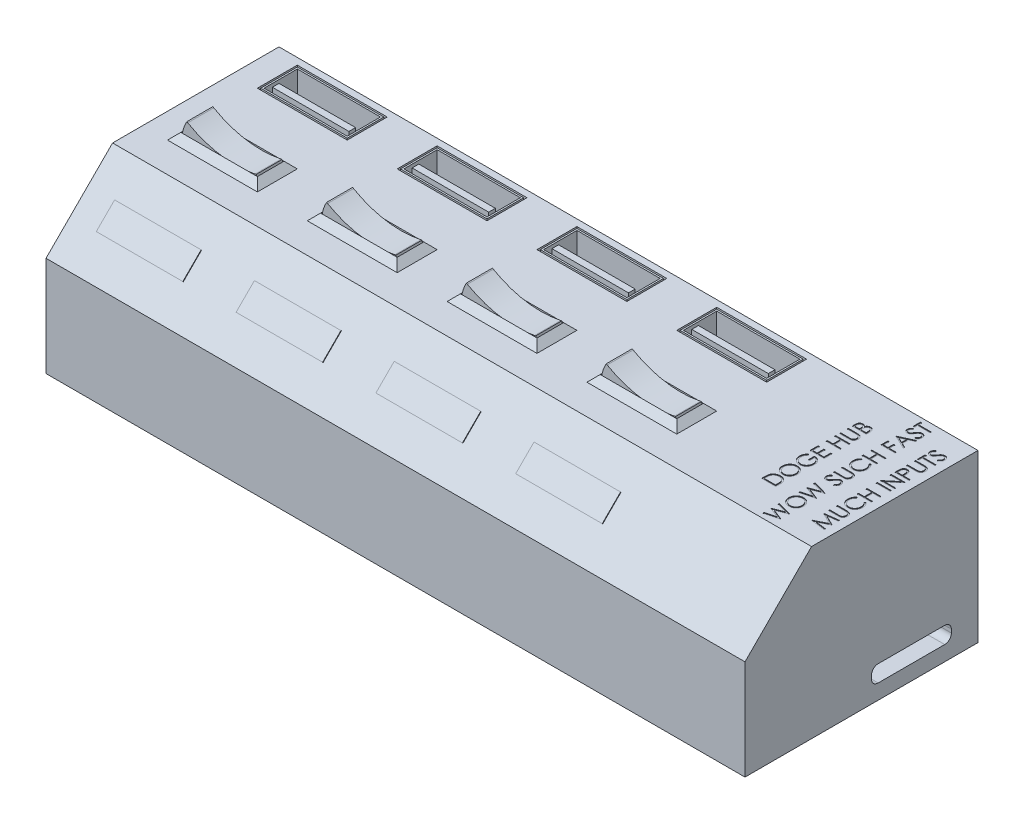
from build123d import *

# Parameters (mm, degrees)
ESBO_O1_W                = 105
ESBO_O1_H                = 35
RESSALTO_EXTRUS_O1_DEPTH = 25
CHANFRO1_SIZE            = 10
ESBO_O2_W                = 13.5
ESBO_O2_H                = 6
ESBO_O2_W_2              = 13
ESBO_O2_H_2              = 5.5
ESBO_O2_W_3              = 12.5
ESBO_O2_H_3              = 5
ESBO_O2_W_4              = 11.5
ESBO_O2_H_4              = 1
CORTE_EXTRUS_O1_DEPTH    = 15
ESBO_O3_W                = 13.5
ESBO_O3_H                = 6
RESSALTO_EXTRUS_O2_DEPTH = 1
RESSALTO_EXTRUS_O2_TAPER = 45
ESBO_O4_W                = 11.5
ESBO_O4_H                = 4
CORTE_EXTRUS_O2_DEPTH    = 1
RESSALTO_EXTRUS_O3_DEPTH = 1.95
ESBO_O6_W                = 13
ESBO_O6_H                = 3.889087296
RESSALTO_EXTRUS_O4_DEPTH = 0.1
PADR_O_LINEAR1_COUNT     = 4
PADR_O_LINEAR1_PITCH     = 21
ESBO_O8_W                = 2.116666666
ESBO_O8_H                = 0.189957265
CORTE_EXTRUS_O3_DEPTH    = 0.1
CORTE_EXTRUS_O4_DEPTH    = 10


with BuildPart() as part:
    # Esboço1 → Ressalto-extrusão1 (new body)
    with BuildSketch(Plane(origin=(0, 0, 0), x_dir=(1, 0, 0), z_dir=(0, 1, 0))):
        Rectangle(ESBO_O1_W, ESBO_O1_H)
    extrude(amount=RESSALTO_EXTRUS_O1_DEPTH)

    # Chanfro1
    chanfro1_edges = [part.edges().sort_by_distance(p)[0] for p in [
        (0, 25, 17.5),
    ]]
    chamfer(chanfro1_edges, length=CHANFRO1_SIZE)

    # Esboço2 → Corte-extrusão1 (cut)
    # profile 1 of 8: a face of its own
    with BuildSketch(Plane(origin=(0, 25, 0), x_dir=(1, 0, 0), z_dir=(0, 1, 0))):
        with Locations((-42, 13.5)):
            Rectangle(ESBO_O2_W, ESBO_O2_H)
        with Locations((-42, 13.5)):
            Rectangle(ESBO_O2_W_2, ESBO_O2_H_2, mode=Mode.SUBTRACT)
    # profile 2 of 8: a face of its own
    with BuildSketch(Plane(origin=(0, 25, 0), x_dir=(1, 0, 0), z_dir=(0, 1, 0))):
        with Locations((-21, 13.5)):
            Rectangle(ESBO_O2_W, ESBO_O2_H)
        with Locations((-21, 13.5)):
            Rectangle(ESBO_O2_W_2, ESBO_O2_H_2, mode=Mode.SUBTRACT)
    # profile 3 of 8: a face of its own
    with BuildSketch(Plane(origin=(0, 25, 0), x_dir=(1, 0, 0), z_dir=(0, 1, 0))):
        with Locations((0, 13.5)):
            Rectangle(ESBO_O2_W, ESBO_O2_H)
        with Locations((0, 13.5)):
            Rectangle(ESBO_O2_W_2, ESBO_O2_H_2, mode=Mode.SUBTRACT)
    # profile 4 of 8: a face of its own
    with BuildSketch(Plane(origin=(0, 25, 0), x_dir=(1, 0, 0), z_dir=(0, 1, 0))):
        with Locations((21, 13.5)):
            Rectangle(ESBO_O2_W, ESBO_O2_H)
        with Locations((21, 13.5)):
            Rectangle(ESBO_O2_W_2, ESBO_O2_H_2, mode=Mode.SUBTRACT)
    # profile 5 of 8: a face of its own
    with BuildSketch(Plane(origin=(0, 25, 0), x_dir=(1, 0, 0), z_dir=(0, 1, 0))):
        with Locations((-42, 13.5)):
            Rectangle(ESBO_O2_W_3, ESBO_O2_H_3)
        with Locations((-42, 12.25)):
            Rectangle(ESBO_O2_W_4, ESBO_O2_H_4, mode=Mode.SUBTRACT)
    # profile 6 of 8: a face of its own
    with BuildSketch(Plane(origin=(0, 25, 0), x_dir=(1, 0, 0), z_dir=(0, 1, 0))):
        with Locations((-21, 13.5)):
            Rectangle(ESBO_O2_W_3, ESBO_O2_H_3)
        with Locations((-21, 12.25)):
            Rectangle(ESBO_O2_W_4, ESBO_O2_H_4, mode=Mode.SUBTRACT)
    # profile 7 of 8: a face of its own
    with BuildSketch(Plane(origin=(0, 25, 0), x_dir=(1, 0, 0), z_dir=(0, 1, 0))):
        with Locations((0, 13.5)):
            Rectangle(ESBO_O2_W_3, ESBO_O2_H_3)
        with Locations((0, 12.25)):
            Rectangle(ESBO_O2_W_4, ESBO_O2_H_4, mode=Mode.SUBTRACT)
    # profile 8 of 8: a face of its own
    with BuildSketch(Plane(origin=(0, 25, 0), x_dir=(1, 0, 0), z_dir=(0, 1, 0))):
        with Locations((21, 13.5)):
            Rectangle(ESBO_O2_W_3, ESBO_O2_H_3)
        with Locations((21, 12.25)):
            Rectangle(ESBO_O2_W_4, ESBO_O2_H_4, mode=Mode.SUBTRACT)
    extrude(amount=-CORTE_EXTRUS_O1_DEPTH, mode=Mode.SUBTRACT)

    # Esboço3 → Ressalto-extrusão2 (add)
    with BuildSketch(Plane(origin=(0, 25, 0), x_dir=(1, 0, 0), z_dir=(0, 1, 0))):
        with Locations((-42, 0)):
            Rectangle(ESBO_O3_W, ESBO_O3_H)
    ressalto_extrus_o2 = extrude(amount=RESSALTO_EXTRUS_O2_DEPTH, taper=RESSALTO_EXTRUS_O2_TAPER)

    # Esboço4 → Corte-extrusão2 (cut)
    with BuildSketch(Plane(origin=(0, 26, 0), x_dir=(1, 0, 0), z_dir=(0, 1, 0))):
        with Locations((-42, 0)):
            Rectangle(ESBO_O4_W, ESBO_O4_H)
    corte_extrus_o2 = extrude(amount=-CORTE_EXTRUS_O2_DEPTH, mode=Mode.SUBTRACT)

    # Esboço5 → Ressalto-extrusão3 (add, symmetric)
    with BuildSketch(Plane.XY):
        with BuildLine():
            Line((-47.65, 25), (-36.35, 25))
            ThreePointArc((-36.35, 25), (-36.382218002, 25.578007783), (-36.473411835, 26.149684862))
            Line((-36.473411835, 26.149684862), (-36.630697706, 26.116252718))
            ThreePointArc((-36.630697706, 26.116252718), (-41.840847735, 25.979820138), (-46.753834885, 27.719600134))
            Line((-46.753834885, 27.719600134), (-46.893091537, 27.8))
            ThreePointArc((-46.893091537, 27.8), (-47.454282243, 26.449398137), (-47.65, 25))
        make_face()
    ressalto_extrus_o3 = extrude(amount=RESSALTO_EXTRUS_O3_DEPTH, both=True)

    # Esboço6 → Ressalto-extrusão4 (add)
    with BuildSketch(Plane(origin=(0, 16.25, 16.25), x_dir=(1, 0, 0), z_dir=(0, 0.7071067811865467, 0.7071067811865485))):
        with Locations((-42, 5.303300859)):
            Rectangle(ESBO_O6_W, ESBO_O6_H)
    ressalto_extrus_o4 = extrude(amount=RESSALTO_EXTRUS_O4_DEPTH)

    # Padrão linear1: Ressalto-extrusão2, Corte-extrusão2, Ressalto-extrusão3, Ressalto-extrusão4 ×4
    with Locations(*[(i * PADR_O_LINEAR1_PITCH, 0, 0) for i in range(1, PADR_O_LINEAR1_COUNT)]):
        add(ressalto_extrus_o2)
        add(corte_extrus_o2, mode=Mode.SUBTRACT)
        add(ressalto_extrus_o3)
        add(ressalto_extrus_o4)

    # Esboço8 → Corte-extrusão3 (cut)
    # profile 1 of 28: a face of its own
    with BuildSketch(Plane(origin=(0, 25, 0), x_dir=(1, 0, 0), z_dir=(0, 1, 0))):
        with BuildLine():
            Line((39.883333333, 11.214316239), (39.883333333, 11.627303686))
            add(Edge.make_bspline(
                [(39.883333333, 11.627303686), (39.883437947, 11.647520275), (39.883640715, 11.686705056), (39.886858492, 11.743681052), (39.891136221, 11.797065581), (39.898311883, 11.846764304), (39.905752097, 11.893100606), (39.916672551, 11.935604074), (39.92873459, 11.974630728), (39.947293673, 12.021493752), (39.976116165, 12.074666273), (40.018862658, 12.131816785), (40.070112251, 12.181495496), (40.128515205, 12.223737127), (40.192765073, 12.257636934), (40.261479498, 12.281851682), (40.333502442, 12.297408158), (40.382880829, 12.298987932), (40.407835871, 12.299786325)],
                knots=[0, 0, 0, 0, 1.00128172, 1.940733171, 2.826250472, 3.653024905, 4.427672124, 5.149348099, 5.824709082, 6.450061444, 7.643590664, 8.808605388, 9.972104426, 11.165284501, 12.367876273, 13.557044126, 14.765369432, 16, 16, 16, 16], degree=3))
            add(Edge.make_bspline(
                [(40.407835871, 12.299786325), (40.431210436, 12.299121322), (40.477143661, 12.297814529), (40.544210451, 12.285470752), (40.607987047, 12.265879413), (40.668418866, 12.238803393), (40.724380966, 12.203917455), (40.77569999, 12.162119199), (40.820436362, 12.111898927), (40.845437106, 12.074253643), (40.858136351, 12.055131544)],
                knots=[0, 0, 0, 0, 1.044641374, 2.052818814, 3.038628718, 4.023282556, 5.005660861, 5.98021751, 6.974042014, 8, 8, 8, 8], degree=3))
            add(Edge.make_bspline(
                [(40.858136351, 12.055131544), (40.867371031, 12.079174814), (40.885039259, 12.125175545), (40.916227639, 12.188515781), (40.950272737, 12.242888404), (40.986877297, 12.289355556), (41.026915033, 12.328887075), (41.07071123, 12.363123655), (41.118230036, 12.392721847), (41.169296804, 12.417909703), (41.223478617, 12.437695078), (41.280113699, 12.452237054), (41.338984938, 12.460838949), (41.37893614, 12.46201238), (41.399175347, 12.462606838)],
                knots=[0, 0, 0, 0, 1.272586185, 2.434772614, 3.483318042, 4.437947805, 5.351807173, 6.25737843, 7.180033415, 8.1141739, 9.066731021, 10.025721652, 10.999834114, 12, 12, 12, 12], degree=3))
            add(Edge.make_bspline(
                [(41.399175347, 12.462606838), (41.419838254, 12.462016207), (41.460493102, 12.460854126), (41.520215244, 12.452276775), (41.577294031, 12.43776376), (41.632072354, 12.417738652), (41.684435362, 12.391782778), (41.734193363, 12.359738799), (41.781449877, 12.322056548), (41.826288305, 12.279469513), (41.867316877, 12.232009595), (41.902587612, 12.17970571), (41.932915418, 12.12399073), (41.957607236, 12.064152393), (41.976656957, 12.000343453), (41.989929373, 11.932599417), (41.998887312, 11.86103185), (41.999622811, 11.811918926), (42, 11.786732105)],
                knots=[0, 0, 0, 0, 0.978680899, 1.925582087, 2.851223405, 3.764209995, 4.683484765, 5.614004905, 6.562443559, 7.542772147, 8.539900013, 9.527881485, 10.525548727, 11.540192123, 12.58875426, 13.674701727, 14.807505862, 16, 16, 16, 16], degree=3))
            Line((42, 11.786732105), (42, 11.214316239))
            Line((42, 11.214316239), (39.883333333, 11.214316239))
        make_face()
        with BuildLine():
            Line((40.10042735, 11.404273504), (40.778846154, 11.404273504))
            Line((40.778846154, 11.404273504), (40.778846154, 11.531901042))
            add(Edge.make_bspline(
                [(40.778846154, 11.531901042), (40.778604296, 11.550557218), (40.778136976, 11.586604752), (40.776798325, 11.638807737), (40.773049986, 11.687264297), (40.769302718, 11.731890781), (40.763210008, 11.772616946), (40.755957572, 11.809352453), (40.748287618, 11.842674199), (40.735242441, 11.881099596), (40.715969283, 11.924692673), (40.686029877, 11.971134294), (40.650398204, 12.012266459), (40.608899612, 12.046583735), (40.563700349, 12.07491777), (40.515197221, 12.094766653), (40.464366291, 12.107999312), (40.429403411, 12.109212896), (40.411651976, 12.10982906)],
                knots=[0, 0, 0, 0, 1.156917035, 2.235399477, 3.236897345, 4.169954739, 5.01148057, 5.788325709, 6.491867502, 7.129259015, 8.302032419, 9.437271567, 10.542795419, 11.662606952, 12.764338259, 13.836858145, 14.901724648, 16, 16, 16, 16], degree=3))
            add(Edge.make_bspline(
                [(40.411651976, 12.10982906), (40.39990247, 12.10951621), (40.37685453, 12.10890252), (40.343146799, 12.103693813), (40.311473895, 12.095254324), (40.281531839, 12.083824981), (40.254064762, 12.068210803), (40.227760217, 12.050111919), (40.204193716, 12.027766277), (40.182230677, 12.002513718), (40.162573831, 11.973620286), (40.14629118, 11.940463472), (40.131533689, 11.90390043), (40.120609156, 11.862939185), (40.111002743, 11.818428468), (40.104966969, 11.769765587), (40.101082892, 11.717258908), (40.100650738, 11.680878375), (40.10042735, 11.66207265)],
                knots=[0, 0, 0, 0, 0.911708768, 1.788416306, 2.640049961, 3.452993646, 4.268229297, 5.087074648, 5.92553149, 6.781184137, 7.681934069, 8.628939405, 9.643570426, 10.73771997, 11.914765019, 13.176320755, 14.540391495, 16, 16, 16, 16], degree=3))
            Line((40.10042735, 11.66207265), (40.10042735, 11.404273504))
        make_face(mode=Mode.SUBTRACT)
        with BuildLine():
            Line((40.995940171, 11.404273504), (41.782905983, 11.404273504))
            Line((41.782905983, 11.404273504), (41.782905983, 11.674793002))
            add(Edge.make_bspline(
                [(41.782905983, 11.674793002), (41.782650831, 11.694154804), (41.782159059, 11.731472123), (41.781005752, 11.785394352), (41.776642967, 11.835241505), (41.772618317, 11.881170831), (41.765736339, 11.923060434), (41.759241541, 11.961232531), (41.749600478, 11.995060501), (41.73634997, 12.034647053), (41.715137553, 12.078895668), (41.68414641, 12.127251439), (41.645898557, 12.169416922), (41.602398867, 12.205612053), (41.555231929, 12.235481847), (41.50501436, 12.256916249), (41.452722796, 12.270236351), (41.417060429, 12.271843546), (41.399175347, 12.272649573)],
                knots=[0, 0, 0, 0, 1.160376723, 2.23647316, 3.230273494, 4.158083346, 4.997711197, 5.773399541, 6.476071462, 7.102777513, 8.27340052, 9.405620712, 10.53304798, 11.669441455, 12.787990954, 13.865552736, 14.929550474, 16, 16, 16, 16], degree=3))
            add(Edge.make_bspline(
                [(41.399175347, 12.272649573), (41.387991039, 12.272483107), (41.365802825, 12.27215286), (41.333200103, 12.267149699), (41.30160291, 12.259911712), (41.270879575, 12.250379074), (41.241546671, 12.237052961), (41.213491705, 12.220716262), (41.186149519, 12.202016009), (41.151135482, 12.173165054), (41.111294365, 12.130588405), (41.072769276, 12.070082236), (41.041198338, 12.001664439), (41.027851497, 11.951925712), (41.020956864, 11.926231971)],
                knots=[0, 0, 0, 0, 0.723302347, 1.434937762, 2.129609326, 2.821140842, 3.513216847, 4.209993937, 4.920569932, 5.655069131, 7.14393391, 8.6716197, 10.280644748, 12, 12, 12, 12], degree=3))
            add(Edge.make_bspline(
                [(41.020956864, 11.926231971), (41.018867361, 11.915933423), (41.014336887, 11.893604045), (41.00955461, 11.857192794), (41.005294026, 11.815623959), (41.002142516, 11.768801553), (40.99888494, 11.716666335), (40.997618072, 11.65910696), (40.996106614, 11.596358489), (40.995997071, 11.552820244), (40.995940171, 11.530204995)],
                knots=[0, 0, 0, 0, 0.634451884, 1.375622551, 2.216452059, 3.157844607, 4.20941857, 5.370758133, 6.634282058, 8, 8, 8, 8], degree=3))
            Line((40.995940171, 11.530204995), (40.995940171, 11.404273504))
        make_face(mode=Mode.SUBTRACT)
    # profile 2 of 28: a face of its own
    with BuildSketch(Plane(origin=(0, 25, 0), x_dir=(1, 0, 0), z_dir=(0, 1, 0))):
        with BuildLine():
            Line((39.883333333, 9.287606838), (39.883333333, 9.477564103))
            Line((39.883333333, 9.477564103), (41.151552484, 9.477564103))
            add(Edge.make_bspline(
                [(41.151552484, 9.477564103), (41.169502262, 9.477535834), (41.20356506, 9.477482188), (41.252047794, 9.477840518), (41.295150662, 9.478844041), (41.33303981, 9.479476718), (41.365541377, 9.480884201), (41.392831446, 9.482032068), (41.414780797, 9.483508023), (41.427590214, 9.485281861), (41.433096287, 9.486044338)],
                knots=[0, 0, 0, 0, 1.528628734, 2.90083645, 4.128790002, 5.200304208, 6.127813768, 6.898992206, 7.526736466, 8, 8, 8, 8], degree=3))
            add(Edge.make_bspline(
                [(41.433096287, 9.486044338), (41.453113064, 9.489139801), (41.491754551, 9.495115455), (41.546741118, 9.51099165), (41.596388996, 9.532157177), (41.641818067, 9.558414278), (41.682739623, 9.59159024), (41.719467744, 9.63277922), (41.752844269, 9.681242757), (41.781943801, 9.736286509), (41.806113414, 9.794935724), (41.824198488, 9.855087827), (41.835266542, 9.915581884), (41.836544753, 9.956087582), (41.837179487, 9.976201923)],
                knots=[0, 0, 0, 0, 1.042777144, 2.01303441, 2.939567723, 3.817555404, 4.708046775, 5.641195415, 6.651191522, 7.732783915, 8.843021186, 9.914367358, 10.964315445, 12, 12, 12, 12], degree=3))
            add(Edge.make_bspline(
                [(41.837179487, 9.976201923), (41.836533663, 9.993471656), (41.835245746, 10.027911375), (41.827172122, 10.079055511), (41.812908351, 10.129024379), (41.793478491, 10.177425429), (41.769584971, 10.223472064), (41.740960924, 10.265983705), (41.707619451, 10.304081038), (41.670667898, 10.338846977), (41.62902777, 10.36894306), (41.583703641, 10.395552704), (41.533486962, 10.416685653), (41.49821714, 10.427385201), (41.480161592, 10.43286258)],
                knots=[0, 0, 0, 0, 0.994718802, 1.98369237, 2.973235266, 3.981451368, 4.982709966, 5.955777334, 6.925228988, 7.892833478, 8.871333226, 9.877970804, 10.913677552, 12, 12, 12, 12], degree=3))
            add(Edge.make_bspline(
                [(41.480161592, 10.43286258), (41.472693645, 10.434676942), (41.456052048, 10.43872007), (41.427917744, 10.442498045), (41.394722748, 10.446432944), (41.356228556, 10.449163184), (41.312564158, 10.451824874), (41.263502088, 10.453417256), (41.209220498, 10.454153271), (41.171339929, 10.454372607), (41.151552484, 10.454487179)],
                knots=[0, 0, 0, 0, 0.558680831, 1.244966039, 2.062412453, 2.990489873, 4.051219941, 5.244515665, 6.560634259, 8, 8, 8, 8], degree=3))
            Line((41.151552484, 10.454487179), (39.883333333, 10.454487179))
            Line((39.883333333, 10.454487179), (39.883333333, 10.644444444))
            Line((39.883333333, 10.644444444), (41.161728766, 10.644444444))
            add(Edge.make_bspline(
                [(41.161728766, 10.644444444), (41.18476921, 10.64429074), (41.229734036, 10.643990777), (41.295623731, 10.641390256), (41.358127453, 10.63724233), (41.417254884, 10.631387031), (41.472790047, 10.62361105), (41.525098737, 10.615043693), (41.573892559, 10.603942513), (41.619734467, 10.591071897), (41.663592189, 10.57656847), (41.705133813, 10.557453876), (41.745579421, 10.53601162), (41.784476129, 10.510785935), (41.821576811, 10.481764883), (41.85784186, 10.450060294), (41.892190481, 10.414554672), (41.925046308, 10.376296742), (41.955602236, 10.335543732), (41.98219282, 10.292032502), (42.003844766, 10.246003271), (42.023061295, 10.198545979), (42.036719914, 10.148522809), (42.047105186, 10.096556871), (42.052956538, 10.042339928), (42.053830794, 10.00547173), (42.054273504, 9.986802217)],
                knots=[0, 0, 0, 0, 1.316707045, 2.569633854, 3.76780728, 4.896239288, 5.964314126, 6.972204208, 7.924543903, 8.822147865, 9.693191779, 10.560896119, 11.431827672, 12.307838457, 13.206132673, 14.12176355, 15.058527151, 16.026630406, 17.00238624, 17.966538933, 18.934743273, 19.906713913, 20.888635248, 21.892958714, 22.933025263, 24, 24, 24, 24], degree=3))
            add(Edge.make_bspline(
                [(42.054273504, 9.986802217), (42.053799237, 9.966440278), (42.052868726, 9.926490225), (42.047528405, 9.867625977), (42.037495208, 9.81118543), (42.024637177, 9.756617739), (42.00719312, 9.70445009), (41.985759027, 9.654697855), (41.961288753, 9.606789775), (41.932373266, 9.561805208), (41.900842873, 9.519375132), (41.866210195, 9.480815894), (41.829794219, 9.445148664), (41.790223703, 9.413945576), (41.74830869, 9.386026423), (41.703852034, 9.36200642), (41.656913333, 9.341374076), (41.624284235, 9.330726561), (41.607789129, 9.325343884)],
                knots=[0, 0, 0, 0, 1.138939089, 2.234594419, 3.301501784, 4.342532435, 5.367382236, 6.373123747, 7.370098489, 8.372230273, 9.360297234, 10.323289009, 11.268038109, 12.20748145, 13.137029304, 14.081414587, 15.030090602, 16, 16, 16, 16], degree=3))
            add(Edge.make_bspline(
                [(41.607789129, 9.325343884), (41.596520858, 9.322212936), (41.572079727, 9.315421839), (41.531629327, 9.308149398), (41.485053638, 9.30203581), (41.432349474, 9.296287211), (41.373475983, 9.292895127), (41.308458686, 9.289921247), (41.237218967, 9.287585887), (41.187595522, 9.287599659), (41.161728766, 9.287606838)],
                knots=[0, 0, 0, 0, 0.625038921, 1.35572334, 2.194682327, 3.136881307, 4.189498639, 5.346923369, 6.617055217, 8, 8, 8, 8], degree=3))
            Line((41.161728766, 9.287606838), (39.883333333, 9.287606838))
        make_face()
    # profile 3 of 28: a face of its own
    with BuildSketch(Plane(origin=(0, 25, 0), x_dir=(1, 0, 0), z_dir=(0, 1, 0))):
        Polygon((39.883333333, 7.279487179), (39.883333333, 7.469444444), (40.751709402, 7.469444444), (40.751709402, 8.55491453), (39.883333333, 8.55491453), (39.883333333, 8.744871795), (42, 8.744871795), (42, 8.55491453), (40.968803419, 8.55491453), (40.968803419, 7.469444444), (42, 7.469444444), (42, 7.279487179), align=None)
    # profile 4 of 28: a face of its own
    with BuildSketch(Plane(origin=(0, 25, 0), x_dir=(1, 0, 0), z_dir=(0, 1, 0))):
        Polygon((39.883333333, 4.891452991), (39.883333333, 6.085470085), (40.10042735, 6.085470085), (40.10042735, 5.081410256), (40.751709402, 5.081410256), (40.751709402, 6.085470085), (40.968803419, 6.085470085), (40.968803419, 5.081410256), (41.782905983, 5.081410256), (41.782905983, 6.085470085), (42, 6.085470085), (42, 4.891452991), align=None)
    # profile 5 of 28: a face of its own
    with BuildSketch(Plane(origin=(0, 25, 0), x_dir=(1, 0, 0), z_dir=(0, 1, 0))):
        with BuildLine():
            Line((40.244591346, 4.321581197), (40.398931624, 4.158760684))
            add(Edge.make_bspline(
                [(40.398931624, 4.158760684), (40.371205575, 4.129303288), (40.316414621, 4.071090924), (40.245438108, 3.976022387), (40.18403486, 3.87723099), (40.134447051, 3.774556994), (40.095547761, 3.670692765), (40.067271535, 3.567424255), (40.049364439, 3.465420093), (40.047213652, 3.397587396), (40.046153846, 3.36416266)],
                knots=[0, 0, 0, 0, 1.089067066, 2.152164705, 3.18986567, 4.218445106, 5.218487318, 6.173592265, 7.100032889, 8, 8, 8, 8], degree=3))
            add(Edge.make_bspline(
                [(40.046153846, 3.36416266), (40.046403979, 3.343652342), (40.046903597, 3.302684899), (40.053280336, 3.241832581), (40.062451468, 3.181618471), (40.07572108, 3.12215624), (40.09253894, 3.063330271), (40.113575865, 3.005345163), (40.138102124, 2.948092733), (40.166442791, 2.892112332), (40.197575738, 2.837840555), (40.232076897, 2.786583357), (40.268838272, 2.73801102), (40.308788405, 2.693047453), (40.351535579, 2.65139356), (40.396309953, 2.612283185), (40.443991844, 2.576445249), (40.494385173, 2.544522505), (40.546317561, 2.51569496), (40.599348572, 2.490783487), (40.652985904, 2.469126991), (40.707633438, 2.452632738), (40.762727781, 2.438662209), (40.818557653, 2.42893689), (40.875268848, 2.423435785), (40.913246503, 2.422486011), (40.932338408, 2.422008547)],
                knots=[0, 0, 0, 0, 1.028150113, 2.053633673, 3.06513288, 4.081487945, 5.106702018, 6.131327874, 7.172780699, 8.228344599, 9.276313556, 10.308389736, 11.324843658, 12.329040066, 13.321460474, 14.316307835, 15.308626991, 16.309440696, 17.305625405, 18.28535951, 19.246194545, 20.203493668, 21.145557131, 22.095268976, 23.042464743, 24, 24, 24, 24], degree=3))
            add(Edge.make_bspline(
                [(40.932338408, 2.422008547), (40.951854475, 2.422465865), (40.990833316, 2.423379252), (41.049009235, 2.429217138), (41.106314406, 2.440075765), (41.162838963, 2.454476204), (41.218695399, 2.472783965), (41.273825424, 2.495276581), (41.328223678, 2.522071242), (41.381350147, 2.553017676), (41.43305737, 2.587192449), (41.482171583, 2.624779118), (41.528121222, 2.665840961), (41.571577443, 2.709625084), (41.612265992, 2.756530415), (41.649696431, 2.807012027), (41.684447549, 2.860363271), (41.716137579, 2.916607815), (41.744444891, 2.975151174), (41.769617628, 3.035177683), (41.790348414, 3.096880271), (41.807244329, 3.15993436), (41.821093553, 3.224264866), (41.830003197, 3.290198307), (41.836468603, 3.357249898), (41.836941328, 3.402448975), (41.837179487, 3.425220353)],
                knots=[0, 0, 0, 0, 0.935915162, 1.869274651, 2.799799983, 3.730201895, 4.664668062, 5.616159355, 6.583070886, 7.570012957, 8.562524459, 9.553461134, 10.53281078, 11.515274572, 12.509912756, 13.507571325, 14.526460018, 15.561318395, 16.601025881, 17.643204557, 18.680545676, 19.719612342, 20.772381578, 21.833430283, 22.908478249, 24, 24, 24, 24], degree=3))
            add(Edge.make_bspline(
                [(41.837179487, 3.425220353), (41.836606062, 3.45266356), (41.835480049, 3.506552756), (41.826707451, 3.585766781), (41.813023824, 3.66185346), (41.792922112, 3.734565095), (41.767478298, 3.804165567), (41.736013395, 3.870398177), (41.698858465, 3.933445811), (41.656765891, 3.993035578), (41.609867533, 4.047750819), (41.559711782, 4.097548171), (41.50564883, 4.140715243), (41.448484407, 4.178541478), (41.387671722, 4.209806001), (41.323549082, 4.235475651), (41.256076809, 4.255150042), (41.209454795, 4.263226691), (41.185897436, 4.267307692)],
                knots=[0, 0, 0, 0, 1.130199668, 2.219330667, 3.279027493, 4.311506524, 5.322739849, 6.327972234, 7.327472899, 8.33386792, 9.329086447, 10.29244429, 11.240784345, 12.174119183, 13.111530729, 14.052100829, 15.015757696, 16, 16, 16, 16], degree=3))
            Line((41.185897436, 4.267307692), (41.185897436, 3.561752137))
            Line((41.185897436, 3.561752137), (40.968803419, 3.561752137))
            Line((40.968803419, 3.561752137), (40.968803419, 4.457264957))
            add(Edge.make_bspline(
                [(40.968803419, 4.457264957), (41.009266519, 4.456233325), (41.088460116, 4.454214235), (41.203951661, 4.440051367), (41.313033589, 4.417181381), (41.41582078, 4.385939192), (41.512167572, 4.34549557), (41.602171786, 4.296284565), (41.68525197, 4.237518568), (41.762086367, 4.171290825), (41.830623557, 4.096965612), (41.890861434, 4.016551256), (41.94160254, 3.929914899), (41.982883988, 3.837138492), (42.01510207, 3.738525753), (42.037944881, 3.633848495), (42.051630621, 3.52324867), (42.053379217, 3.447449823), (42.054273504, 3.408683894)],
                knots=[0, 0, 0, 0, 1.140356446, 2.231883559, 3.274166699, 4.278491846, 5.25512956, 6.21435461, 7.1637429, 8.11826594, 9.068280886, 10.0076534, 10.945064095, 11.891975133, 12.864533718, 13.863980011, 14.907571808, 16, 16, 16, 16], degree=3))
            add(Edge.make_bspline(
                [(42.054273504, 3.408683894), (42.053929321, 3.38478967), (42.053250482, 3.337662557), (42.048426086, 3.268059948), (42.040999261, 3.200376435), (42.029783877, 3.134621877), (42.01604692, 3.070554404), (41.99845638, 3.008493988), (41.978094833, 2.94820422), (41.954935069, 2.889591915), (41.928100781, 2.83318907), (41.89828019, 2.778744462), (41.865627062, 2.725957138), (41.829576694, 2.675186672), (41.79039873, 2.626168529), (41.748014645, 2.57921878), (41.702554016, 2.534074587), (41.670272424, 2.50579564), (41.65400641, 2.491546474)],
                knots=[0, 0, 0, 0, 1.107784379, 2.184907829, 3.233506516, 4.263428166, 5.276301166, 6.270063455, 7.25232949, 8.225834625, 9.190232166, 10.146266622, 11.1027726, 12.066435141, 13.031522626, 14.010570082, 14.99756817, 16, 16, 16, 16], degree=3))
            add(Edge.make_bspline(
                [(41.65400641, 2.491546474), (41.628200825, 2.470872125), (41.577018, 2.429866599), (41.49501232, 2.377084095), (41.410102623, 2.332088961), (41.322052538, 2.295580802), (41.230944424, 2.267073483), (41.1368947, 2.246628749), (41.039782257, 2.234650055), (40.974065645, 2.232924345), (40.940818643, 2.232051282)],
                knots=[0, 0, 0, 0, 1.023165419, 2.029347347, 3.013907458, 3.994755782, 4.975994455, 5.96558838, 6.970761222, 8, 8, 8, 8], degree=3))
            add(Edge.make_bspline(
                [(40.940818643, 2.232051282), (40.915922862, 2.232373159), (40.866447709, 2.233012823), (40.792994957, 2.240769208), (40.72084644, 2.251897681), (40.650061154, 2.268254722), (40.58059175, 2.288874796), (40.512406249, 2.314609702), (40.445463368, 2.344571891), (40.380227831, 2.379399958), (40.31755054, 2.41814629), (40.257738215, 2.460242348), (40.201760232, 2.506012958), (40.149486918, 2.555591396), (40.100143515, 2.607978249), (40.05476073, 2.664273298), (40.012628398, 2.723623625), (39.97455609, 2.786489314), (39.940346007, 2.851878367), (39.910357026, 2.919648643), (39.885571693, 2.989775514), (39.864541886, 3.061734656), (39.848990335, 3.136070464), (39.837712288, 3.212243578), (39.829995162, 3.290651026), (39.829374522, 3.343649958), (39.829059829, 3.370522837)],
                knots=[0, 0, 0, 0, 1.00895651, 2.005089799, 2.991467152, 3.967318338, 4.948153826, 5.927364234, 6.919980553, 7.91976625, 8.923240147, 9.905815003, 10.88314567, 11.851989312, 12.825009789, 13.798721852, 14.781296708, 15.773896486, 16.776076962, 17.771600213, 18.775744723, 19.78957137, 20.808953803, 21.851964491, 22.910847925, 24, 24, 24, 24], degree=3))
            add(Edge.make_bspline(
                [(39.829059829, 3.370522837), (39.829410284, 3.392438346), (39.830105194, 3.435894225), (39.834921909, 3.500558835), (39.842556352, 3.564223944), (39.852974456, 3.626983951), (39.867164402, 3.688625134), (39.884145079, 3.749323094), (39.903915848, 3.809165819), (39.927494817, 3.86796576), (39.954257724, 3.926118283), (39.984382984, 3.98394673), (40.018385725, 4.041253512), (40.05636691, 4.09813801), (40.097674216, 4.154958934), (40.143489057, 4.210817551), (40.192004723, 4.267062188), (40.226888711, 4.303228047), (40.244591346, 4.321581197)],
                knots=[0, 0, 0, 0, 0.985871117, 1.954866573, 2.915460327, 3.869826059, 4.81536089, 5.759505086, 6.70452669, 7.649098992, 8.607881297, 9.583363685, 10.581137262, 11.603961102, 12.659522466, 13.73993555, 14.853081303, 16, 16, 16, 16], degree=3))
        make_face()
    # profile 6 of 28: a face of its own
    with BuildSketch(Plane(origin=(0, 25, 0), x_dir=(1, 0, 0), z_dir=(0, 1, 0))):
        with BuildLine():
            add(Edge.make_bspline(
                [(39.829059829, 0.780235043), (39.830035822, 0.81943279), (39.831952751, 0.896420398), (39.847110979, 1.009463414), (39.872059837, 1.11770717), (39.90729295, 1.221213895), (39.952968255, 1.319589927), (40.00845067, 1.413113106), (40.074077372, 1.501503152), (40.148884695, 1.584151641), (40.230810923, 1.65954621), (40.318514504, 1.725705336), (40.410892773, 1.781516802), (40.507950547, 1.827204566), (40.609461223, 1.863072488), (40.715993718, 1.887817027), (40.826850276, 1.90362486), (40.902461808, 1.905472812), (40.940818643, 1.906410256)],
                knots=[0, 0, 0, 0, 1.065064174, 2.09187391, 3.093564831, 4.079973196, 5.057907931, 6.036227367, 7.030399151, 8.044883615, 9.061699972, 10.052012555, 11.025713132, 11.989727027, 12.962874294, 13.945865945, 14.957962116, 16, 16, 16, 16], degree=3))
            add(Edge.make_bspline(
                [(40.940818643, 1.906410256), (40.978892711, 1.905472497), (41.05394111, 1.903624063), (41.164097355, 1.8878042), (41.26997515, 1.862962077), (41.371338504, 1.82764866), (41.46819915, 1.781925837), (41.560647352, 1.726032208), (41.648585189, 1.659998645), (41.731075822, 1.584924239), (41.806535652, 1.502841941), (41.873094162, 1.41547543), (41.928929923, 1.323099625), (41.975127749, 1.226671812), (42.01024819, 1.125434809), (42.03581703, 1.020125319), (42.051467936, 0.910169583), (42.053328053, 0.835266767), (42.054273504, 0.797195513)],
                knots=[0, 0, 0, 0, 1.043748596, 2.057349401, 3.045489418, 4.02252776, 4.995289225, 5.97782527, 6.980224157, 8.006516136, 9.032559198, 10.034193337, 11.013412982, 11.987833483, 12.961212594, 13.946489799, 14.956251404, 16, 16, 16, 16], degree=3))
            add(Edge.make_bspline(
                [(42.054273504, 0.797195513), (42.053336494, 0.758838901), (42.051489398, 0.683227808), (42.035655881, 0.572231601), (42.010896141, 0.465625537), (41.975511863, 0.363714477), (41.929781442, 0.266441591), (41.874019746, 0.173616636), (41.807854475, 0.0856122), (41.732763261, 0.003157905), (41.651016656, -0.072285657), (41.563426416, -0.138059185), (41.471710973, -0.19383342), (41.375615803, -0.239410292), (41.275605455, -0.275493084), (41.171012804, -0.300109808), (41.062434151, -0.316036788), (40.988506303, -0.317872148), (40.950994925, -0.318803419)],
                knots=[0, 0, 0, 0, 1.053102029, 2.075944431, 3.073151272, 4.055350789, 5.033113405, 6.020478099, 7.024410459, 8.052272461, 9.079885166, 10.07527673, 11.055994387, 12.023226415, 12.992069828, 13.970394897, 14.97016774, 16, 16, 16, 16], degree=3))
            add(Edge.make_bspline(
                [(40.950994925, -0.318803419), (40.925817073, -0.318480092), (40.875778998, -0.317837516), (40.801473959, -0.310101588), (40.728363895, -0.298876178), (40.656656702, -0.282788355), (40.586527916, -0.26174768), (40.517493884, -0.236920978), (40.450254203, -0.206598309), (40.384490342, -0.172320013), (40.321227466, -0.134061681), (40.261428861, -0.09180349), (40.204592734, -0.047029719), (40.152191927, 0.002054809), (40.102702049, 0.053832374), (40.056883644, 0.109142917), (40.014323555, 0.167648941), (39.975969349, 0.229602189), (39.941280729, 0.293476098), (39.911513229, 0.359320626), (39.88596442, 0.426241505), (39.865256873, 0.494552173), (39.848908928, 0.56407123), (39.837776861, 0.634950405), (39.830021203, 0.707133229), (39.829381666, 0.755762932), (39.829059829, 0.780235043)],
                knots=[0, 0, 0, 0, 1.037015668, 2.060948919, 3.074880161, 4.083647147, 5.086022904, 6.090072063, 7.104153813, 8.122640571, 9.144368836, 10.147691507, 11.138137339, 12.123020368, 13.103399296, 14.087645067, 15.080126199, 16.082011238, 17.087798457, 18.072939717, 19.057185487, 20.037253025, 21.01195951, 21.997135196, 22.992090687, 24, 24, 24, 24], degree=3))
        make_face()
        with BuildLine():
            add(Edge.make_bspline(
                [(40.046153846, 0.789563301), (40.046397854, 0.769476099), (40.046883538, 0.729493731), (40.053316145, 0.670058785), (40.062418584, 0.611387458), (40.075638516, 0.553593287), (40.092737925, 0.496555066), (40.113361162, 0.440247472), (40.138287434, 0.384863567), (40.166320056, 0.330472539), (40.19816063, 0.278330643), (40.231972209, 0.228312308), (40.269011078, 0.181718551), (40.308476213, 0.137909306), (40.350710112, 0.096993521), (40.39543542, 0.058989244), (40.442845584, 0.02392764), (40.492745494, -0.007769339), (40.544856545, -0.035977177), (40.598182601, -0.061232837), (40.653350352, -0.082168815), (40.710015535, -0.098753229), (40.76792844, -0.112829596), (40.827404597, -0.121659336), (40.888238971, -0.128155324), (40.92935204, -0.128614104), (40.950146902, -0.128846154)],
                knots=[0, 0, 0, 0, 1.008406545, 2.007172654, 2.999155034, 3.989332444, 4.982025741, 5.988181096, 6.998684226, 8.030553839, 9.059268815, 10.065399129, 11.060956322, 12.046057109, 13.024974577, 14.012068307, 14.991706172, 15.984221787, 16.978487447, 17.966117052, 18.945677757, 19.938371053, 20.93015022, 21.936155317, 22.956113857, 24, 24, 24, 24], degree=3))
            add(Edge.make_bspline(
                [(40.950146902, -0.128846154), (40.980724311, -0.128073402), (41.040879536, -0.12655316), (41.129044475, -0.113299226), (41.213857207, -0.092721184), (41.294812213, -0.062886911), (41.372270495, -0.024827408), (41.445930613, 0.021597459), (41.515770838, 0.076812844), (41.581271279, 0.139495782), (41.641032327, 0.208037923), (41.693562601, 0.280784705), (41.737773545, 0.357160583), (41.774732901, 0.436725345), (41.802576542, 0.520158303), (41.822429045, 0.606924516), (41.835296017, 0.697025902), (41.836545706, 0.758424774), (41.837179487, 0.789563301)],
                knots=[0, 0, 0, 0, 1.032022337, 2.030307203, 3.003823408, 3.974715386, 4.937372378, 5.913284036, 6.909147208, 7.938749767, 8.970518239, 9.975863271, 10.963918693, 11.946286286, 12.933361397, 13.927862637, 14.949112547, 16, 16, 16, 16], degree=3))
            add(Edge.make_bspline(
                [(41.837179487, 0.789563301), (41.836892152, 0.810493892), (41.836322281, 0.852005539), (41.830574443, 0.913747815), (41.821375548, 0.974383482), (41.808065613, 1.033800507), (41.791627975, 1.092076739), (41.77123878, 1.149036338), (41.746797022, 1.204660386), (41.719557492, 1.259222397), (41.688614119, 1.311500677), (41.655258351, 1.361215612), (41.618873019, 1.407729095), (41.579937917, 1.451517786), (41.537833845, 1.49214682), (41.49338035, 1.530042891), (41.445869562, 1.56449827), (41.396174031, 1.596087797), (41.3444429, 1.624639813), (41.29097024, 1.649164946), (41.236042843, 1.670109916), (41.179620351, 1.686993936), (41.121829682, 1.70023107), (41.062588126, 1.709350386), (41.002015636, 1.7157298), (40.961046724, 1.716210616), (40.940394631, 1.716452991)],
                knots=[0, 0, 0, 0, 1.047334373, 2.07717862, 3.100662057, 4.115010574, 5.122652213, 6.129548646, 7.140165612, 8.16200981, 9.179904151, 10.178566626, 11.156366481, 12.133321541, 13.108841334, 14.082538371, 15.054589433, 16.043660176, 17.028268541, 18.009491307, 18.985652105, 19.968123554, 20.954864208, 21.950389976, 22.966808393, 24, 24, 24, 24], degree=3))
            add(Edge.make_bspline(
                [(40.940394631, 1.716452991), (40.919883826, 1.716210414), (40.879196867, 1.715729216), (40.819046753, 1.709353529), (40.760231715, 1.700221086), (40.702982654, 1.687059829), (40.647284973, 1.670096165), (40.593190991, 1.649179063), (40.540499165, 1.624513676), (40.489339805, 1.596205813), (40.440248238, 1.564385888), (40.393317914, 1.529615111), (40.349426225, 1.491295839), (40.307504443, 1.450512877), (40.26839109, 1.406285713), (40.232237294, 1.35860663), (40.197414085, 1.308662773), (40.166595159, 1.255324701), (40.137991435, 1.200475356), (40.113588069, 1.144142001), (40.092629033, 1.087129159), (40.075587471, 1.029208884), (40.062469222, 0.970408551), (40.053307999, 0.910762357), (40.046885747, 0.8504785), (40.046398587, 0.809932802), (40.046153846, 0.789563301)],
                knots=[0, 0, 0, 0, 1.029877221, 2.042951179, 3.035109885, 4.018542222, 4.991021277, 5.957494829, 6.929429462, 7.911425532, 8.892163142, 9.866273635, 10.842761649, 11.81676864, 12.802607151, 13.805177466, 14.821356543, 15.858816981, 16.897175917, 17.927346774, 18.940346092, 19.946830556, 20.957962087, 21.964146003, 22.97721996, 24, 24, 24, 24], degree=3))
        make_face(mode=Mode.SUBTRACT)
    # profile 7 of 28: a face of its own
    with BuildSketch(Plane(origin=(0, 25, 0), x_dir=(1, 0, 0), z_dir=(0, 1, 0))):
        with BuildLine():
            Line((42, -2.381196581), (39.883333333, -2.381196581))
            Line((39.883333333, -2.381196581), (39.883333333, -1.953792735))
            add(Edge.make_bspline(
                [(39.883333333, -1.953792735), (39.883600983, -1.916618633), (39.88411808, -1.84479846), (39.887396731, -1.74101379), (39.893196679, -1.644987419), (39.901644917, -1.557035166), (39.912018418, -1.476915576), (39.925021043, -1.404852989), (39.940374842, -1.340474789), (39.953465185, -1.300881365), (39.959655449, -1.28215812)],
                knots=[0, 0, 0, 0, 1.314313732, 2.53924729, 3.670748893, 4.714932338, 5.66265055, 6.526160246, 7.303039223, 8, 8, 8, 8], degree=3))
            add(Edge.make_bspline(
                [(39.959655449, -1.28215812), (39.968984446, -1.257666238), (39.987430889, -1.20923787), (40.022280935, -1.140322724), (40.061605366, -1.075225734), (40.106309145, -1.01446591), (40.155808518, -0.9578908), (40.209749859, -0.904858292), (40.269331454, -0.856675905), (40.333492785, -0.812593196), (40.401411766, -0.772836187), (40.472977161, -0.7382813), (40.54782058, -0.709582742), (40.625735232, -0.685759272), (40.706892072, -0.666983542), (40.7913857, -0.654173521), (40.878882161, -0.645724397), (40.938254337, -0.644875281), (40.968379407, -0.644444444)],
                knots=[0, 0, 0, 0, 0.984741985, 1.947153288, 2.898543998, 3.841229145, 4.778974371, 5.722123648, 6.681464302, 7.655713756, 8.646344578, 9.637374342, 10.639946623, 11.656849581, 12.698333139, 13.76849723, 14.867749466, 16, 16, 16, 16], degree=3))
            add(Edge.make_bspline(
                [(40.968379407, -0.644444444), (40.994542156, -0.64482482), (41.046098585, -0.645574391), (41.122081416, -0.652304973), (41.195810087, -0.66208781), (41.266933579, -0.677233531), (41.336074766, -0.695620016), (41.402497726, -0.719183307), (41.4668082, -0.74617988), (41.528149754, -0.777647639), (41.586227789, -0.81224099), (41.641017748, -0.849133761), (41.691303822, -0.889162651), (41.738403736, -0.931142927), (41.781059267, -0.976086937), (41.820047969, -1.023447494), (41.854717087, -1.073408654), (41.885611412, -1.126279691), (41.913239352, -1.182766711), (41.936284369, -1.244646517), (41.956243706, -1.311625996), (41.97212136, -1.384087116), (41.984926802, -1.46177143), (41.993452714, -1.544894436), (41.999234893, -1.633299042), (41.999740012, -1.694004808), (42, -1.725250401)],
                knots=[0, 0, 0, 0, 1.106010661, 2.179509527, 3.223302912, 4.248870533, 5.252098245, 6.246278179, 7.226402005, 8.199283979, 9.158616973, 10.083547221, 10.989831858, 11.874256832, 12.749262829, 13.607058236, 14.46581075, 15.317568432, 16.194266721, 17.121067875, 18.106207572, 19.147242834, 20.255495536, 21.43354536, 22.679031616, 24, 24, 24, 24], degree=3))
            Line((42, -1.725250401), (42, -2.381196581))
        make_face()
        with BuildLine():
            Line((41.782905983, -2.191239316), (41.782905983, -1.948280582))
            add(Edge.make_bspline(
                [(41.782905983, -1.948280582), (41.782755944, -1.913368663), (41.782467363, -1.846220256), (41.779935102, -1.749665182), (41.775797359, -1.66144288), (41.770006717, -1.581540824), (41.762345221, -1.510004129), (41.753803018, -1.446683289), (41.74316075, -1.391785871), (41.733514218, -1.35856664), (41.72905649, -1.343215812)],
                knots=[0, 0, 0, 0, 1.375205317, 2.645023457, 3.804390687, 4.853969522, 5.800190428, 6.637939096, 7.370582563, 8, 8, 8, 8], degree=3))
            add(Edge.make_bspline(
                [(41.72905649, -1.343215812), (41.722251978, -1.323894658), (41.708805478, -1.285713834), (41.684277732, -1.230752445), (41.655223786, -1.179494531), (41.622927877, -1.131047431), (41.586252409, -1.08609604), (41.545989343, -1.044116466), (41.501954728, -1.005160104), (41.454219968, -0.969826988), (41.403302687, -0.937823317), (41.349112836, -0.910349508), (41.292412242, -0.886423419), (41.232741881, -0.86747829), (41.170539105, -0.852540885), (41.105481367, -0.8420706), (41.037626234, -0.835570488), (40.991432221, -0.83479555), (40.967955395, -0.834401709)],
                knots=[0, 0, 0, 0, 0.998590647, 1.973329978, 2.929871262, 3.868367705, 4.809062953, 5.754642869, 6.701828697, 7.672172887, 8.647399344, 9.630604387, 10.631475358, 11.644913558, 12.679592956, 13.747988925, 14.855477812, 16, 16, 16, 16], degree=3))
            add(Edge.make_bspline(
                [(40.967955395, -0.834401709), (40.943200386, -0.834712126), (40.89456895, -0.835321942), (40.823212673, -0.842986882), (40.754583898, -0.854188014), (40.688678037, -0.870385767), (40.62536651, -0.891026822), (40.564999473, -0.916786439), (40.506939386, -0.946218156), (40.452526317, -0.981235888), (40.401065246, -1.019587223), (40.353921083, -1.062149084), (40.310986435, -1.108245269), (40.27159266, -1.157373011), (40.237324627, -1.210916876), (40.206671254, -1.267615536), (40.180656881, -1.328300776), (40.166820617, -1.370520835), (40.159788996, -1.391977163)],
                knots=[0, 0, 0, 0, 1.122418816, 2.205001699, 3.251619955, 4.274784885, 5.280384055, 6.268708349, 7.249350384, 8.229342522, 9.199999885, 10.157847722, 11.105861043, 12.055065948, 13.010012805, 13.98527497, 14.976112212, 16, 16, 16, 16], degree=3))
            add(Edge.make_bspline(
                [(40.159788996, -1.391977163), (40.154880489, -1.409727619), (40.144443658, -1.447469957), (40.13305879, -1.509058585), (40.123017021, -1.578373461), (40.114515255, -1.655722328), (40.108414827, -1.741017015), (40.103835984, -1.834323121), (40.100747688, -1.935680978), (40.100536803, -2.005943748), (40.10042735, -2.042411191)],
                knots=[0, 0, 0, 0, 0.674548936, 1.434276114, 2.292660221, 3.240891867, 4.284742987, 5.42552168, 6.663806718, 8, 8, 8, 8], degree=3))
            Line((40.10042735, -2.042411191), (40.10042735, -2.191239316))
            Line((40.10042735, -2.191239316), (41.782905983, -2.191239316))
        make_face(mode=Mode.SUBTRACT)
    # profile 8 of 28: a face of its own
    with BuildSketch(Plane(origin=(0, 25, 0), x_dir=(1, 0, 0), z_dir=(0, 1, 0))):
        Polygon((44.709615385, 15.73258547), (44.492521368, 15.73258547), (44.492521368, 16.845192308), (44.709615385, 16.845192308), (44.709615385, 16.383867521), (46.609188034, 16.383867521), (46.609188034, 16.193910256), (44.709615385, 16.193910256), align=None)
    # profile 9 of 28: a face of its own
    with BuildSketch(Plane(origin=(0, 25, 0), x_dir=(1, 0, 0), z_dir=(0, 1, 0))):
        with BuildLine():
            Line((46.200864717, 14.294337607), (46.093589744, 14.473270566))
            add(Edge.make_bspline(
                [(46.093589744, 14.473270566), (46.121447729, 14.489912548), (46.174822553, 14.521797942), (46.246945273, 14.574987574), (46.308245244, 14.630101287), (46.358365859, 14.687547217), (46.3978259, 14.746974719), (46.42576725, 14.808771742), (46.443194054, 14.872730037), (46.445310773, 14.916257062), (46.446367521, 14.937987447)],
                knots=[0, 0, 0, 0, 1.272034388, 2.437168799, 3.508375237, 4.49857839, 5.41946034, 6.295179144, 7.148887113, 8, 8, 8, 8], degree=3))
            add(Edge.make_bspline(
                [(46.446367521, 14.937987447), (46.445838351, 14.956541934), (46.44478927, 14.993326248), (46.435116224, 15.04758482), (46.41929114, 15.100017079), (46.397838525, 15.150101814), (46.371468598, 15.196512109), (46.340373505, 15.237862041), (46.304444237, 15.272777675), (46.265011806, 15.301723158), (46.222727014, 15.324120962), (46.179158543, 15.34104944), (46.1337086, 15.3505303), (46.103100094, 15.351952985), (46.087653579, 15.35267094)],
                knots=[0, 0, 0, 0, 1.09553864, 2.171907928, 3.244545276, 4.325730702, 5.384330216, 6.391480148, 7.371786628, 8.333890167, 9.27165687, 10.191402356, 11.087295184, 12, 12, 12, 12], degree=3))
            add(Edge.make_bspline(
                [(46.087653579, 15.35267094), (46.070024421, 15.351798483), (46.034323454, 15.350031662), (45.98156075, 15.334460552), (45.929120477, 15.31068412), (45.89667668, 15.288336945), (45.879887821, 15.276772837)],
                knots=[0, 0, 0, 0, 0.938992559, 1.901562324, 2.914110574, 4, 4, 4, 4], degree=3))
            add(Edge.make_bspline(
                [(45.879887821, 15.276772837), (45.867762732, 15.267297235), (45.842307627, 15.247404396), (45.804449089, 15.213176173), (45.76531891, 15.173216163), (45.724058046, 15.128071283), (45.681009203, 15.077665807), (45.635836451, 15.021980231), (45.589462899, 14.960539313), (45.55840159, 14.917414139), (45.542374466, 14.89516226)],
                knots=[0, 0, 0, 0, 0.72225051, 1.516274602, 2.393638633, 3.3469932, 4.386926276, 5.505032946, 6.712638081, 8, 8, 8, 8], degree=3))
            add(Edge.make_bspline(
                [(45.542374466, 14.89516226), (45.526512415, 14.87289251), (45.496185382, 14.830314443), (45.451176411, 14.770770443), (45.41002607, 14.717524506), (45.372346977, 14.670813292), (45.338134021, 14.630657345), (45.307715744, 14.596740234), (45.280269495, 14.569925964), (45.262464493, 14.555015208), (45.254470486, 14.548320646)],
                knots=[0, 0, 0, 0, 1.452282411, 2.77665338, 3.964542531, 5.026858415, 5.96415736, 6.766646006, 7.446254459, 8, 8, 8, 8], degree=3))
            add(Edge.make_bspline(
                [(45.254470486, 14.548320646), (45.242011145, 14.538965009), (45.21750818, 14.520565892), (45.179220531, 14.496252673), (45.140101455, 14.475749269), (45.100009176, 14.459247862), (45.059245011, 14.4459038), (45.017502918, 14.436626253), (44.975066268, 14.43090777), (44.94651433, 14.430317067), (44.932221554, 14.430021368)],
                knots=[0, 0, 0, 0, 1.068019517, 2.100403715, 3.106014851, 4.09224787, 5.069873182, 6.043214339, 7.020455327, 8, 8, 8, 8], degree=3))
            add(Edge.make_bspline(
                [(44.932221554, 14.430021368), (44.909827314, 14.430810673), (44.865517493, 14.432372413), (44.80078996, 14.445581236), (44.73898914, 14.466427229), (44.680741116, 14.495641274), (44.627509384, 14.533265458), (44.578814808, 14.576995323), (44.537319945, 14.628597755), (44.501630003, 14.685725483), (44.473406233, 14.747927724), (44.452952368, 14.813413158), (44.440803029, 14.881711053), (44.439107954, 14.928045476), (44.438247863, 14.951555823)],
                knots=[0, 0, 0, 0, 1.005248779, 1.989011071, 2.95484373, 3.928844559, 4.904706341, 5.875556129, 6.859318422, 7.868909462, 8.894684146, 9.918924798, 10.944050749, 12, 12, 12, 12], degree=3))
            add(Edge.make_bspline(
                [(44.438247863, 14.951555823), (44.439096487, 14.976502722), (44.440784128, 15.026114143), (44.455822912, 15.098973268), (44.479757818, 15.169408444), (44.507839734, 15.225817756), (44.535708332, 15.27005996), (44.561147405, 15.303766423), (44.590373305, 15.338108544), (44.624002158, 15.372717248), (44.661361353, 15.407934195), (44.70276714, 15.443597167), (44.747846384, 15.480039909), (44.780035911, 15.50347666), (44.796537794, 15.515491453)],
                knots=[0, 0, 0, 0, 1.286507425, 2.558452658, 3.822738219, 5.118007103, 5.800084425, 6.519418873, 7.295692132, 8.12638276, 9.008892966, 9.945018126, 10.946518512, 12, 12, 12, 12], degree=3))
            Line((44.796537794, 15.515491453), (44.926709402, 15.343766693))
            add(Edge.make_bspline(
                [(44.926709402, 15.343766693), (44.91335023, 15.333398243), (44.887623589, 15.313431031), (44.851607411, 15.28310457), (44.818663549, 15.254564465), (44.790124496, 15.226230382), (44.763853135, 15.200286305), (44.741759772, 15.174658808), (44.723146361, 15.15033686), (44.703246148, 15.119752682), (44.684116428, 15.081009534), (44.667313219, 15.03278055), (44.657344658, 14.982208952), (44.656015005, 14.947783048), (44.65534188, 14.930355235)],
                knots=[0, 0, 0, 0, 1.181392137, 2.275085037, 3.289537922, 4.225335853, 5.084247276, 5.86831218, 6.587234301, 7.222706459, 8.415108401, 9.595592188, 10.782789524, 12, 12, 12, 12], degree=3))
            add(Edge.make_bspline(
                [(44.65534188, 14.930355235), (44.656062671, 14.908483988), (44.657452649, 14.866307347), (44.673032751, 14.806568367), (44.696721247, 14.752489682), (44.73087981, 14.706135737), (44.771603398, 14.667862004), (44.818045781, 14.639832683), (44.869339586, 14.623074444), (44.905103382, 14.621023265), (44.923317308, 14.619978632)],
                knots=[0, 0, 0, 0, 1.144248881, 2.206576175, 3.214949548, 4.222996039, 5.203671638, 6.127710127, 7.046472867, 8, 8, 8, 8], degree=3))
            add(Edge.make_bspline(
                [(44.923317308, 14.619978632), (44.934654887, 14.620229962), (44.957487983, 14.620736123), (44.991061406, 14.627204041), (45.024457807, 14.635949197), (45.057559649, 14.649355941), (45.091116499, 14.668025942), (45.125602322, 14.692516985), (45.161314159, 14.723369426), (45.184541534, 14.747001484), (45.196804888, 14.759478499)],
                knots=[0, 0, 0, 0, 0.858259122, 1.72847414, 2.583651051, 3.473048463, 4.427392529, 5.488649985, 6.674082839, 8, 8, 8, 8], degree=3))
            add(Edge.make_bspline(
                [(45.196804888, 14.759478499), (45.200939661, 14.764111805), (45.210762934, 14.77511948), (45.226844932, 14.795243492), (45.2466828, 14.821818423), (45.271228462, 14.854150325), (45.299701537, 14.892835349), (45.33173796, 14.937877747), (45.368377737, 14.988775436), (45.393993964, 15.024892975), (45.407538729, 15.043990385)],
                knots=[0, 0, 0, 0, 0.420754252, 0.999615792, 1.744751191, 2.668019286, 3.750313428, 4.999500688, 6.413464383, 8, 8, 8, 8], degree=3))
            add(Edge.make_bspline(
                [(45.407538729, 15.043990385), (45.424255182, 15.066962802), (45.456624276, 15.111445703), (45.505256456, 15.17473884), (45.552820178, 15.232126249), (45.599008607, 15.283813661), (45.643481716, 15.330297488), (45.686740076, 15.371109148), (45.728500004, 15.406433812), (45.781674755, 15.444982698), (45.847586806, 15.483905645), (45.928377902, 15.517278873), (46.009400842, 15.53851035), (46.063787626, 15.541267733), (46.090621661, 15.542628205)],
                knots=[0, 0, 0, 0, 1.163604038, 2.253157948, 3.268574773, 4.215621239, 5.091738613, 5.902582348, 6.650434646, 7.330118262, 8.591011492, 9.77460283, 10.902005569, 12, 12, 12, 12], degree=3))
            add(Edge.make_bspline(
                [(46.090621661, 15.542628205), (46.1095979, 15.542230388), (46.147181872, 15.541442479), (46.202372389, 15.532400578), (46.255962091, 15.519122494), (46.307235566, 15.499270654), (46.357015511, 15.474645639), (46.404364167, 15.443846835), (46.450201418, 15.407960399), (46.493242207, 15.3668155), (46.532802238, 15.321816575), (46.567847287, 15.274084622), (46.597740995, 15.22411792), (46.621548402, 15.171375364), (46.640293895, 15.116423547), (46.653837912, 15.059081259), (46.662159672, 14.999290414), (46.663022738, 14.958649893), (46.663461538, 14.937987447)],
                knots=[0, 0, 0, 0, 0.983922938, 1.948738757, 2.895227473, 3.844781104, 4.796118043, 5.772795661, 6.770647148, 7.813532943, 8.8582745, 9.876489951, 10.882905461, 11.874265028, 12.874055871, 13.891769171, 14.928133632, 16, 16, 16, 16], degree=3))
            add(Edge.make_bspline(
                [(46.663461538, 14.937987447), (46.663152395, 14.922000358), (46.662538002, 14.890227522), (46.657106467, 14.843231788), (46.649421692, 14.797185467), (46.637221191, 14.752666345), (46.62241842, 14.709100895), (46.604192008, 14.666678399), (46.582349309, 14.625379029), (46.557377154, 14.584968539), (46.528307814, 14.545560535), (46.494480486, 14.507481913), (46.456757757, 14.46973093), (46.414556875, 14.43257538), (46.367413777, 14.396825878), (46.316030679, 14.361624194), (46.260254778, 14.327141883), (46.221031165, 14.305476604), (46.200864717, 14.294337607)],
                knots=[0, 0, 0, 0, 0.915313873, 1.819100311, 2.706792138, 3.586475221, 4.459428225, 5.3405999, 6.2277379, 7.133009489, 8.059106158, 9.028520402, 10.047404263, 11.114294124, 12.246039232, 13.433834781, 14.680630578, 16, 16, 16, 16], degree=3))
        make_face()
    # profile 10 of 28: a face of its own
    with BuildSketch(Plane(origin=(0, 25, 0), x_dir=(1, 0, 0), z_dir=(0, 1, 0))):
        Polygon((44.492521368, 13.208867521), (46.609188034, 14.185790598), (46.609188034, 13.979296875), (45.930769231, 13.666376202), (45.930769231, 12.706837607), (46.609188034, 12.385012687), (46.609188034, 12.17767094), (44.492521368, 13.181730769), align=None)
        Polygon((44.905084802, 13.193179087), (45.713675214, 12.809872463), (45.713675214, 13.566309428), align=None, mode=Mode.SUBTRACT)
    # profile 11 of 28: a face of its own
    with BuildSketch(Plane(origin=(0, 25, 0), x_dir=(1, 0, 0), z_dir=(0, 1, 0))):
        Polygon((44.492521368, 10.929380342), (44.492521368, 11.960576923), (44.709615385, 11.960576923), (44.709615385, 11.119337607), (45.360897436, 11.119337607), (45.360897436, 11.960576923), (45.577991453, 11.960576923), (45.577991453, 11.119337607), (46.609188034, 11.119337607), (46.609188034, 10.929380342), align=None)
    # profile 12 of 28: a face of its own
    with BuildSketch(Plane(origin=(0, 25, 0), x_dir=(1, 0, 0), z_dir=(0, 1, 0))):
        Polygon((44.492521368, 8.10715812), (44.492521368, 8.297115385), (45.360897436, 8.297115385), (45.360897436, 9.38258547), (44.492521368, 9.38258547), (44.492521368, 9.572542735), (46.609188034, 9.572542735), (46.609188034, 9.38258547), (45.577991453, 9.38258547), (45.577991453, 8.297115385), (46.609188034, 8.297115385), (46.609188034, 8.10715812), align=None)
    # profile 13 of 28: a face of its own
    with BuildSketch(Plane(origin=(0, 25, 0), x_dir=(1, 0, 0), z_dir=(0, 1, 0))):
        with BuildLine():
            Line((44.880916132, 7.672970085), (45.008119658, 7.506757479))
            add(Edge.make_bspline(
                [(45.008119658, 7.506757479), (44.993988997, 7.494900463), (44.965918186, 7.471346289), (44.926497333, 7.433454177), (44.889577664, 7.393955548), (44.854921964, 7.352905361), (44.823923117, 7.309353619), (44.794166906, 7.264959765), (44.768114321, 7.218110775), (44.736287828, 7.153656544), (44.703801021, 7.069010646), (44.675859563, 6.962823623), (44.658240322, 6.851822104), (44.656319094, 6.776110259), (44.65534188, 6.73760016)],
                knots=[0, 0, 0, 0, 0.75789156, 1.505565099, 2.245254514, 2.979266606, 3.711207489, 4.440978832, 5.174393176, 5.91211879, 7.394186119, 8.890401545, 10.418332761, 12, 12, 12, 12], degree=3))
            add(Edge.make_bspline(
                [(44.65534188, 6.73760016), (44.655586181, 6.716383117), (44.656072516, 6.674145946), (44.662488511, 6.611463297), (44.671506243, 6.549951119), (44.684886796, 6.489649423), (44.70180357, 6.430634966), (44.722017988, 6.372521945), (44.747027813, 6.316151715), (44.774670455, 6.260744532), (44.805892665, 6.207658872), (44.839949203, 6.157430839), (44.876456789, 6.110240687), (44.91556025, 6.066061848), (44.957054085, 6.024809532), (45.001403162, 5.987002839), (45.048133376, 5.952136642), (45.097283533, 5.920409653), (45.148395876, 5.891847994), (45.201762226, 5.86783208), (45.256468842, 5.846856743), (45.312903557, 5.829998015), (45.370691274, 5.8167577), (45.430071394, 5.807603956), (45.490931334, 5.801262318), (45.532181657, 5.800778212), (45.55297476, 5.800534188)],
                knots=[0, 0, 0, 0, 1.054877232, 2.099964208, 3.13098259, 4.145888998, 5.169474743, 6.183358035, 7.203388855, 8.234598956, 9.261847606, 10.264062591, 11.251197969, 12.227332808, 13.196685059, 14.158975844, 15.123498106, 16.094582253, 17.066912473, 18.032714859, 19.002806091, 19.979168736, 20.95977404, 21.949109834, 22.966205168, 24, 24, 24, 24], degree=3))
            add(Edge.make_bspline(
                [(45.55297476, 5.800534188), (45.584259194, 5.801299077), (45.645682031, 5.802800836), (45.735662729, 5.816109428), (45.821947048, 5.836495583), (45.903950764, 5.866548646), (45.982357479, 5.904345141), (46.05621635, 5.951504745), (46.126609432, 6.006330551), (46.191831844, 6.069385002), (46.25140835, 6.138575111), (46.30387202, 6.212807886), (46.347605247, 6.29190137), (46.383997383, 6.374981488), (46.411971685, 6.462687766), (46.431665228, 6.55486243), (46.444511689, 6.651305018), (46.445741586, 6.71720556), (46.446367521, 6.750744525)],
                knots=[0, 0, 0, 0, 1.029159485, 2.020618137, 2.987588728, 3.942669054, 4.889339625, 5.846988364, 6.821327795, 7.821533711, 8.827683044, 9.822769455, 10.807800696, 11.797391277, 12.803701919, 13.832062008, 14.896664671, 16, 16, 16, 16], degree=3))
            add(Edge.make_bspline(
                [(46.446367521, 6.750744525), (46.445346212, 6.787697103), (46.44333603, 6.860428618), (46.426306389, 6.967089281), (46.398694219, 7.06919472), (46.36005119, 7.166750427), (46.309816469, 7.25948138), (46.248918228, 7.347532694), (46.176777189, 7.430978691), (46.121693583, 7.481156562), (46.093589744, 7.506757479)],
                knots=[0, 0, 0, 0, 1.028121516, 2.023589091, 2.998037872, 3.967518031, 4.937445131, 5.927275754, 6.942489185, 8, 8, 8, 8], degree=3))
            Line((46.093589744, 7.506757479), (46.219521234, 7.672970085))
            add(Edge.make_bspline(
                [(46.219521234, 7.672970085), (46.236779605, 7.659593426), (46.271213681, 7.632904181), (46.319767812, 7.589696051), (46.365396683, 7.544145223), (46.407872426, 7.496134613), (46.447370855, 7.4455796), (46.483913425, 7.392484823), (46.517306205, 7.336895602), (46.547979113, 7.279253477), (46.574985568, 7.219425624), (46.598917233, 7.157938732), (46.618730008, 7.094415799), (46.635489393, 7.02939155), (46.647439588, 6.96227872), (46.656955787, 6.893857449), (46.662601502, 6.823487337), (46.663172288, 6.776053871), (46.663461538, 6.75201656)],
                knots=[0, 0, 0, 0, 0.986911346, 1.969095443, 2.935967484, 3.900112155, 4.865124501, 5.834589912, 6.812044781, 7.795288262, 8.784678562, 9.777857908, 10.776141921, 11.791195789, 12.811324908, 13.855933174, 14.913475973, 16, 16, 16, 16], degree=3))
            add(Edge.make_bspline(
                [(46.663461538, 6.75201656), (46.663303095, 6.729251104), (46.662989794, 6.684235234), (46.657914531, 6.617772656), (46.650990166, 6.553069433), (46.640563991, 6.490310493), (46.62826051, 6.429153356), (46.611767892, 6.370152431), (46.59329292, 6.312727137), (46.571578952, 6.257108188), (46.547076308, 6.203248274), (46.519383318, 6.151321112), (46.488732857, 6.101350584), (46.455800541, 6.052845401), (46.419528554, 6.0065221), (46.380420637, 5.961979254), (46.338608602, 5.91896709), (46.308458286, 5.892355942), (46.293299279, 5.878976362)],
                knots=[0, 0, 0, 0, 1.114604814, 2.203992996, 3.262667896, 4.300477797, 5.318619304, 6.316056647, 7.298880507, 8.271930387, 9.238335007, 10.195173496, 11.151986948, 12.108099108, 13.064862484, 14.031167946, 15.010108607, 16, 16, 16, 16], degree=3))
            add(Edge.make_bspline(
                [(46.293299279, 5.878976362), (46.266966683, 5.857547633), (46.214619402, 5.81494888), (46.129787783, 5.76042372), (46.041295255, 5.713906092), (45.948629252, 5.675875024), (45.851753752, 5.646662727), (45.7508246, 5.626124583), (45.646043557, 5.612871351), (45.57478136, 5.611350156), (45.53855836, 5.610576923)],
                knots=[0, 0, 0, 0, 0.994611881, 1.977215934, 2.950189954, 3.921972279, 4.908960509, 5.911694611, 6.938501887, 8, 8, 8, 8], degree=3))
            add(Edge.make_bspline(
                [(45.53855836, 5.610576923), (45.5004853, 5.611517445), (45.425578931, 5.613367863), (45.315648969, 5.62908913), (45.210328837, 5.654379544), (45.109815144, 5.69030052), (45.013579213, 5.735842328), (44.922356199, 5.79210128), (44.835562705, 5.85842379), (44.754515689, 5.9342897), (44.680408557, 6.017485183), (44.615211472, 6.10657799), (44.560953736, 6.201393739), (44.515598914, 6.300887868), (44.480737739, 6.405805399), (44.456333668, 6.515922484), (44.441143793, 6.631032209), (44.439223549, 6.709568057), (44.438247863, 6.749472489)],
                knots=[0, 0, 0, 0, 1.032925535, 2.032216505, 3.007276963, 3.968222605, 4.92396291, 5.891752235, 6.871517503, 7.883894988, 8.900124299, 9.891468569, 10.874487609, 11.85992873, 12.854644235, 13.869047385, 14.917252991, 16, 16, 16, 16], degree=3))
            add(Edge.make_bspline(
                [(44.438247863, 6.749472489), (44.438539696, 6.77379259), (44.439117348, 6.821931781), (44.444741673, 6.893145255), (44.454137224, 6.962472316), (44.466858184, 7.029985875), (44.482877666, 7.095881118), (44.502843073, 7.160034765), (44.526613292, 7.222289721), (44.55375778, 7.282625762), (44.584281602, 7.340635585), (44.61782472, 7.396282773), (44.654217649, 7.449345476), (44.693832971, 7.499547896), (44.736342081, 7.546951456), (44.781247045, 7.592259342), (44.829700157, 7.634152687), (44.863812889, 7.660007267), (44.880916132, 7.672970085)],
                knots=[0, 0, 0, 0, 1.096622143, 2.170653093, 3.219033441, 4.250379162, 5.267604342, 6.275621678, 7.278284436, 8.271072515, 9.257558938, 10.232633088, 11.19973724, 12.157384997, 13.114417402, 14.069920322, 15.032307892, 16, 16, 16, 16], degree=3))
        make_face()
    # profile 14 of 28: a face of its own
    with BuildSketch(Plane(origin=(0, 25, 0), x_dir=(1, 0, 0), z_dir=(0, 1, 0))):
        with BuildLine():
            Line((44.492521368, 3.79241453), (44.492521368, 3.982371795))
            Line((44.492521368, 3.982371795), (45.760740518, 3.982371795))
            add(Edge.make_bspline(
                [(45.760740518, 3.982371795), (45.778690296, 3.982343526), (45.812753094, 3.982289881), (45.861235828, 3.98264821), (45.904338696, 3.983651733), (45.942227845, 3.984284411), (45.974729411, 3.985691893), (46.00201948, 3.98683976), (46.023968831, 3.988315716), (46.036778248, 3.990089553), (46.042284322, 3.99085203)],
                knots=[0, 0, 0, 0, 1.528628734, 2.90083645, 4.128790002, 5.200304208, 6.127813768, 6.898992206, 7.526736466, 8, 8, 8, 8], degree=3))
            add(Edge.make_bspline(
                [(46.042284322, 3.99085203), (46.062301098, 3.993947494), (46.100942585, 3.999923147), (46.155929152, 4.015799343), (46.20557703, 4.036964869), (46.251006101, 4.063221971), (46.291927658, 4.096397932), (46.328655778, 4.137586912), (46.362032303, 4.186050449), (46.391131835, 4.241094201), (46.415301449, 4.299743416), (46.433386523, 4.359895519), (46.444454576, 4.420389577), (46.445732787, 4.460895275), (46.446367521, 4.481009615)],
                knots=[0, 0, 0, 0, 1.042777144, 2.01303441, 2.939567723, 3.817555404, 4.708046775, 5.641195415, 6.651191522, 7.732783915, 8.843021186, 9.914367358, 10.964315445, 12, 12, 12, 12], degree=3))
            add(Edge.make_bspline(
                [(46.446367521, 4.481009615), (46.445721698, 4.498279348), (46.44443378, 4.532719068), (46.436360156, 4.583863203), (46.422096385, 4.633832071), (46.402666525, 4.682233122), (46.378773006, 4.728279756), (46.350148958, 4.770791397), (46.316807486, 4.80888873), (46.279855932, 4.84365467), (46.238215804, 4.873750753), (46.192891675, 4.900360396), (46.142674996, 4.921493345), (46.107405174, 4.932192893), (46.089349626, 4.937670272)],
                knots=[0, 0, 0, 0, 0.994718802, 1.98369237, 2.973235266, 3.981451368, 4.982709966, 5.955777334, 6.925228988, 7.892833478, 8.871333226, 9.877970804, 10.913677552, 12, 12, 12, 12], degree=3))
            add(Edge.make_bspline(
                [(46.089349626, 4.937670272), (46.081881679, 4.939484634), (46.065240082, 4.943527763), (46.037105778, 4.947305737), (46.003910782, 4.951240636), (45.96541659, 4.953970876), (45.921752193, 4.956632566), (45.872690123, 4.958224949), (45.818408532, 4.958960964), (45.780527963, 4.959180299), (45.760740518, 4.959294872)],
                knots=[0, 0, 0, 0, 0.558680831, 1.244966039, 2.062412453, 2.990489873, 4.051219941, 5.244515665, 6.560634259, 8, 8, 8, 8], degree=3))
            Line((45.760740518, 4.959294872), (44.492521368, 4.959294872))
            Line((44.492521368, 4.959294872), (44.492521368, 5.149252137))
            Line((44.492521368, 5.149252137), (45.7709168, 5.149252137))
            add(Edge.make_bspline(
                [(45.7709168, 5.149252137), (45.793957244, 5.149098433), (45.838922071, 5.148798469), (45.904811765, 5.146197949), (45.967315487, 5.142050023), (46.026442919, 5.136194723), (46.081978081, 5.128418743), (46.134286771, 5.119851385), (46.183080593, 5.108750205), (46.228922502, 5.095879589), (46.272780223, 5.081376163), (46.314321847, 5.062261568), (46.354767455, 5.040819312), (46.393664163, 5.015593627), (46.430764845, 4.986572575), (46.467029894, 4.954867986), (46.501378515, 4.919362364), (46.534234342, 4.881104434), (46.56479027, 4.840351425), (46.591380855, 4.796840194), (46.6130328, 4.750810963), (46.632249329, 4.703353671), (46.645907948, 4.653330501), (46.65629322, 4.601364563), (46.662144572, 4.54714762), (46.663018828, 4.510279423), (46.663461538, 4.491609909)],
                knots=[0, 0, 0, 0, 1.316707045, 2.569633854, 3.76780728, 4.896239288, 5.964314126, 6.972204208, 7.924543903, 8.822147865, 9.693191779, 10.560896119, 11.431827672, 12.307838457, 13.206132673, 14.12176355, 15.058527151, 16.026630406, 17.00238624, 17.966538933, 18.934743273, 19.906713913, 20.888635248, 21.892958714, 22.933025263, 24, 24, 24, 24], degree=3))
            add(Edge.make_bspline(
                [(46.663461538, 4.491609909), (46.662987271, 4.47124797), (46.662056761, 4.431297918), (46.656716439, 4.372433669), (46.646683243, 4.315993122), (46.633825212, 4.261425431), (46.616381155, 4.209257782), (46.594947061, 4.159505547), (46.570476787, 4.111597467), (46.5415613, 4.066612901), (46.510030908, 4.024182824), (46.475398229, 3.985623586), (46.438982254, 3.949956357), (46.399411737, 3.918753268), (46.357496724, 3.890834116), (46.313040069, 3.866814112), (46.266101367, 3.846181769), (46.233472269, 3.835534253), (46.216977163, 3.830151576)],
                knots=[0, 0, 0, 0, 1.138939089, 2.234594419, 3.301501784, 4.342532435, 5.367382236, 6.373123747, 7.370098489, 8.372230273, 9.360297234, 10.323289009, 11.268038109, 12.20748145, 13.137029304, 14.081414587, 15.030090602, 16, 16, 16, 16], degree=3))
            add(Edge.make_bspline(
                [(46.216977163, 3.830151576), (46.205708892, 3.827020628), (46.181267761, 3.820229532), (46.140817361, 3.81295709), (46.094241673, 3.806843502), (46.041537508, 3.801094903), (45.982664017, 3.797702819), (45.917646721, 3.794728939), (45.846407001, 3.792393579), (45.796783556, 3.792407351), (45.7709168, 3.79241453)],
                knots=[0, 0, 0, 0, 0.625038921, 1.35572334, 2.194682327, 3.136881307, 4.189498639, 5.346923369, 6.617055217, 8, 8, 8, 8], degree=3))
            Line((45.7709168, 3.79241453), (44.492521368, 3.79241453))
        make_face()
    # profile 15 of 28: a face of its own
    with BuildSketch(Plane(origin=(0, 25, 0), x_dir=(1, 0, 0), z_dir=(0, 1, 0))):
        with BuildLine():
            Line((46.200864717, 2.109935897), (46.093589744, 2.288868857))
            add(Edge.make_bspline(
                [(46.093589744, 2.288868857), (46.121447729, 2.305510838), (46.174822553, 2.337396233), (46.246945273, 2.390585864), (46.308245244, 2.445699577), (46.358365859, 2.503145508), (46.3978259, 2.56257301), (46.42576725, 2.624370033), (46.443194054, 2.688328328), (46.445310773, 2.731855353), (46.446367521, 2.753585737)],
                knots=[0, 0, 0, 0, 1.272034388, 2.437168799, 3.508375237, 4.49857839, 5.41946034, 6.295179144, 7.148887113, 8, 8, 8, 8], degree=3))
            add(Edge.make_bspline(
                [(46.446367521, 2.753585737), (46.445838351, 2.772140224), (46.44478927, 2.808924539), (46.435116224, 2.863183111), (46.41929114, 2.91561537), (46.397838525, 2.965700105), (46.371468598, 3.012110399), (46.340373505, 3.053460332), (46.304444237, 3.088375966), (46.265011806, 3.117321449), (46.222727014, 3.139719253), (46.179158543, 3.156647731), (46.1337086, 3.16612859), (46.103100094, 3.167551276), (46.087653579, 3.168269231)],
                knots=[0, 0, 0, 0, 1.09553864, 2.171907928, 3.244545276, 4.325730702, 5.384330216, 6.391480148, 7.371786628, 8.333890167, 9.27165687, 10.191402356, 11.087295184, 12, 12, 12, 12], degree=3))
            add(Edge.make_bspline(
                [(46.087653579, 3.168269231), (46.070024421, 3.167396774), (46.034323454, 3.165629953), (45.98156075, 3.150058843), (45.929120477, 3.12628241), (45.89667668, 3.103935236), (45.879887821, 3.092371127)],
                knots=[0, 0, 0, 0, 0.938992559, 1.901562324, 2.914110574, 4, 4, 4, 4], degree=3))
            add(Edge.make_bspline(
                [(45.879887821, 3.092371127), (45.867762732, 3.082895526), (45.842307627, 3.063002687), (45.804449089, 3.028774463), (45.76531891, 2.988814453), (45.724058046, 2.943669574), (45.681009203, 2.893264098), (45.635836451, 2.837578522), (45.589462899, 2.776137603), (45.55840159, 2.73301243), (45.542374466, 2.71076055)],
                knots=[0, 0, 0, 0, 0.72225051, 1.516274602, 2.393638633, 3.3469932, 4.386926276, 5.505032946, 6.712638081, 8, 8, 8, 8], degree=3))
            add(Edge.make_bspline(
                [(45.542374466, 2.71076055), (45.526512415, 2.6884908), (45.496185382, 2.645912734), (45.451176411, 2.586368734), (45.41002607, 2.533122797), (45.372346977, 2.486411582), (45.338134021, 2.446255635), (45.307715744, 2.412338525), (45.280269495, 2.385524255), (45.262464493, 2.370613499), (45.254470486, 2.363918937)],
                knots=[0, 0, 0, 0, 1.452282411, 2.77665338, 3.964542531, 5.026858415, 5.96415736, 6.766646006, 7.446254459, 8, 8, 8, 8], degree=3))
            add(Edge.make_bspline(
                [(45.254470486, 2.363918937), (45.242011145, 2.354563299), (45.21750818, 2.336164183), (45.179220531, 2.311850964), (45.140101455, 2.29134756), (45.100009176, 2.274846153), (45.059245011, 2.261502091), (45.017502918, 2.252224544), (44.975066268, 2.24650606), (44.94651433, 2.245915357), (44.932221554, 2.245619658)],
                knots=[0, 0, 0, 0, 1.068019517, 2.100403715, 3.106014851, 4.09224787, 5.069873182, 6.043214339, 7.020455327, 8, 8, 8, 8], degree=3))
            add(Edge.make_bspline(
                [(44.932221554, 2.245619658), (44.909827314, 2.246408964), (44.865517493, 2.247970704), (44.80078996, 2.261179527), (44.73898914, 2.282025519), (44.680741116, 2.311239564), (44.627509384, 2.348863748), (44.578814808, 2.392593614), (44.537319945, 2.444196046), (44.501630003, 2.501323774), (44.473406233, 2.563526015), (44.452952368, 2.629011448), (44.440803029, 2.697309344), (44.439107954, 2.743643767), (44.438247863, 2.767154113)],
                knots=[0, 0, 0, 0, 1.005248779, 1.989011071, 2.95484373, 3.928844559, 4.904706341, 5.875556129, 6.859318422, 7.868909462, 8.894684146, 9.918924798, 10.944050749, 12, 12, 12, 12], degree=3))
            add(Edge.make_bspline(
                [(44.438247863, 2.767154113), (44.439096487, 2.792101013), (44.440784128, 2.841712433), (44.455822912, 2.914571559), (44.479757818, 2.985006734), (44.507839734, 3.041416046), (44.535708332, 3.08565825), (44.561147405, 3.119364714), (44.590373305, 3.153706835), (44.624002158, 3.188315539), (44.661361353, 3.223532486), (44.70276714, 3.259195458), (44.747846384, 3.2956382), (44.780035911, 3.31907495), (44.796537794, 3.331089744)],
                knots=[0, 0, 0, 0, 1.286507425, 2.558452658, 3.822738219, 5.118007103, 5.800084425, 6.519418873, 7.295692132, 8.12638276, 9.008892966, 9.945018126, 10.946518512, 12, 12, 12, 12], degree=3))
            Line((44.796537794, 3.331089744), (44.926709402, 3.159364984))
            add(Edge.make_bspline(
                [(44.926709402, 3.159364984), (44.91335023, 3.148996533), (44.887623589, 3.129029321), (44.851607411, 3.098702861), (44.818663549, 3.070162755), (44.790124496, 3.041828672), (44.763853135, 3.015884596), (44.741759772, 2.990257099), (44.723146361, 2.96593515), (44.703246148, 2.935350972), (44.684116428, 2.896607825), (44.667313219, 2.848378841), (44.657344658, 2.797807243), (44.656015005, 2.763381339), (44.65534188, 2.745953526)],
                knots=[0, 0, 0, 0, 1.181392137, 2.275085037, 3.289537922, 4.225335853, 5.084247276, 5.86831218, 6.587234301, 7.222706459, 8.415108401, 9.595592188, 10.782789524, 12, 12, 12, 12], degree=3))
            add(Edge.make_bspline(
                [(44.65534188, 2.745953526), (44.656062671, 2.724082278), (44.657452649, 2.681905638), (44.673032751, 2.622166657), (44.696721247, 2.568087973), (44.73087981, 2.521734028), (44.771603398, 2.483460294), (44.818045781, 2.455430973), (44.869339586, 2.438672735), (44.905103382, 2.436621556), (44.923317308, 2.435576923)],
                knots=[0, 0, 0, 0, 1.144248881, 2.206576175, 3.214949548, 4.222996039, 5.203671638, 6.127710127, 7.046472867, 8, 8, 8, 8], degree=3))
            add(Edge.make_bspline(
                [(44.923317308, 2.435576923), (44.934654887, 2.435828253), (44.957487983, 2.436334414), (44.991061406, 2.442802332), (45.024457807, 2.451547488), (45.057559649, 2.464954232), (45.091116499, 2.483624233), (45.125602322, 2.508115276), (45.161314159, 2.538967716), (45.184541534, 2.562599775), (45.196804888, 2.57507679)],
                knots=[0, 0, 0, 0, 0.858259122, 1.72847414, 2.583651051, 3.473048463, 4.427392529, 5.488649985, 6.674082839, 8, 8, 8, 8], degree=3))
            add(Edge.make_bspline(
                [(45.196804888, 2.57507679), (45.200939661, 2.579710096), (45.210762934, 2.590717771), (45.226844932, 2.610841783), (45.2466828, 2.637416713), (45.271228462, 2.669748616), (45.299701537, 2.708433639), (45.33173796, 2.753476038), (45.368377737, 2.804373726), (45.393993964, 2.840491266), (45.407538729, 2.859588675)],
                knots=[0, 0, 0, 0, 0.420754252, 0.999615792, 1.744751191, 2.668019286, 3.750313428, 4.999500688, 6.413464383, 8, 8, 8, 8], degree=3))
            add(Edge.make_bspline(
                [(45.407538729, 2.859588675), (45.424255182, 2.882561092), (45.456624276, 2.927043994), (45.505256456, 2.990337131), (45.552820178, 3.04772454), (45.599008607, 3.099411951), (45.643481716, 3.145895779), (45.686740076, 3.186707439), (45.728500004, 3.222032103), (45.781674755, 3.260580988), (45.847586806, 3.299503936), (45.928377902, 3.332877164), (46.009400842, 3.35410864), (46.063787626, 3.356866023), (46.090621661, 3.358226496)],
                knots=[0, 0, 0, 0, 1.163604038, 2.253157948, 3.268574773, 4.215621239, 5.091738613, 5.902582348, 6.650434646, 7.330118262, 8.591011492, 9.77460283, 10.902005569, 12, 12, 12, 12], degree=3))
            add(Edge.make_bspline(
                [(46.090621661, 3.358226496), (46.1095979, 3.357828679), (46.147181872, 3.35704077), (46.202372389, 3.347998869), (46.255962091, 3.334720785), (46.307235566, 3.314868945), (46.357015511, 3.290243929), (46.404364167, 3.259445125), (46.450201418, 3.223558689), (46.493242207, 3.18241379), (46.532802238, 3.137414865), (46.567847287, 3.089682913), (46.597740995, 3.039716211), (46.621548402, 2.986973654), (46.640293895, 2.932021838), (46.653837912, 2.87467955), (46.662159672, 2.814888705), (46.663022738, 2.774248184), (46.663461538, 2.753585737)],
                knots=[0, 0, 0, 0, 0.983922938, 1.948738757, 2.895227473, 3.844781104, 4.796118043, 5.772795661, 6.770647148, 7.813532943, 8.8582745, 9.876489951, 10.882905461, 11.874265028, 12.874055871, 13.891769171, 14.928133632, 16, 16, 16, 16], degree=3))
            add(Edge.make_bspline(
                [(46.663461538, 2.753585737), (46.663152395, 2.737598649), (46.662538002, 2.705825813), (46.657106467, 2.658830078), (46.649421692, 2.612783758), (46.637221191, 2.568264635), (46.62241842, 2.524699185), (46.604192008, 2.482276689), (46.582349309, 2.44097732), (46.557377154, 2.40056683), (46.528307814, 2.361158826), (46.494480486, 2.323080204), (46.456757757, 2.285329221), (46.414556875, 2.24817367), (46.367413777, 2.212424169), (46.316030679, 2.177222485), (46.260254778, 2.142740173), (46.221031165, 2.121074894), (46.200864717, 2.109935897)],
                knots=[0, 0, 0, 0, 0.915313873, 1.819100311, 2.706792138, 3.586475221, 4.459428225, 5.3405999, 6.2277379, 7.133009489, 8.059106158, 9.028520402, 10.047404263, 11.114294124, 12.246039232, 13.433834781, 14.680630578, 16, 16, 16, 16], degree=3))
        make_face()
    # profile 16 of 28: a face of its own
    with BuildSketch(Plane(origin=(0, 25, 0), x_dir=(1, 0, 0), z_dir=(0, 1, 0))):
        Polygon((44.492521368, -1.444978632), (44.492521368, -1.248661191), (46.044828392, -0.834401709), (44.492521368, -0.218312634), (44.492521368, -0.19075187), (46.034228098, 0.413888889), (44.492521368, 0.830268429), (44.492521368, 1.024465812), (46.609188034, 0.453745994), (46.609188034, 0.426609241), (44.990311165, -0.21025641), (46.609188034, -0.854754274), (46.609188034, -0.881891026), align=None)
    # profile 17 of 28: a face of its own
    with BuildSketch(Plane(origin=(0, 25, 0), x_dir=(1, 0, 0), z_dir=(0, 1, 0))):
        with BuildLine():
            add(Edge.make_bspline(
                [(44.438247863, -2.86965812), (44.439223856, -2.830460373), (44.441140785, -2.753472764), (44.456299014, -2.640429748), (44.481247871, -2.532185992), (44.516480985, -2.428679267), (44.562156289, -2.330303235), (44.617638704, -2.236780056), (44.683265406, -2.14839001), (44.758072729, -2.065741521), (44.839998957, -1.990346952), (44.927702538, -1.924187826), (45.020080807, -1.86837636), (45.117138581, -1.822688597), (45.218649258, -1.786820674), (45.325181752, -1.762076136), (45.43603831, -1.746268303), (45.511649842, -1.74442035), (45.550006677, -1.743482906)],
                knots=[0, 0, 0, 0, 1.065064174, 2.09187391, 3.093564831, 4.079973196, 5.057907931, 6.036227367, 7.030399151, 8.044883615, 9.061699972, 10.052012555, 11.025713132, 11.989727027, 12.962874294, 13.945865945, 14.957962116, 16, 16, 16, 16], degree=3))
            add(Edge.make_bspline(
                [(45.550006677, -1.743482906), (45.588080745, -1.744420666), (45.663129144, -1.746269099), (45.77328539, -1.762088962), (45.879163184, -1.786931085), (45.980526538, -1.822244503), (46.077387184, -1.867967326), (46.169835386, -1.923860954), (46.257773223, -1.989894518), (46.340263856, -2.064968923), (46.415723686, -2.147051222), (46.482282196, -2.234417732), (46.538117957, -2.326793538), (46.584315784, -2.423221351), (46.619436224, -2.524458354), (46.645005064, -2.629767843), (46.66065597, -2.73972358), (46.662516087, -2.814626395), (46.663461538, -2.85269765)],
                knots=[0, 0, 0, 0, 1.043748596, 2.057349401, 3.045489418, 4.02252776, 4.995289225, 5.97782527, 6.980224157, 8.006516136, 9.032559198, 10.034193337, 11.013412982, 11.987833483, 12.961212594, 13.946489799, 14.956251404, 16, 16, 16, 16], degree=3))
            add(Edge.make_bspline(
                [(46.663461538, -2.85269765), (46.662524528, -2.891054262), (46.660677432, -2.966665354), (46.644843916, -3.077661561), (46.620084175, -3.184267625), (46.584699897, -3.286178685), (46.538969476, -3.383451571), (46.48320778, -3.476276526), (46.417042509, -3.564280963), (46.341951295, -3.646735257), (46.26020469, -3.72217882), (46.17261445, -3.787952347), (46.080899007, -3.843726582), (45.984803838, -3.889303455), (45.884793489, -3.925386247), (45.780200838, -3.95000297), (45.671622185, -3.965929951), (45.597694337, -3.96776531), (45.560182959, -3.968696581)],
                knots=[0, 0, 0, 0, 1.053102029, 2.075944431, 3.073151272, 4.055350789, 5.033113405, 6.020478099, 7.024410459, 8.052272461, 9.079885166, 10.07527673, 11.055994387, 12.023226415, 12.992069828, 13.970394897, 14.97016774, 16, 16, 16, 16], degree=3))
            add(Edge.make_bspline(
                [(45.560182959, -3.968696581), (45.535005107, -3.968373254), (45.484967032, -3.967730679), (45.410661993, -3.95999475), (45.337551929, -3.94876934), (45.265844736, -3.932681517), (45.19571595, -3.911640842), (45.126681918, -3.88681414), (45.059442237, -3.856491472), (44.993678376, -3.822213175), (44.9304155, -3.783954844), (44.870616895, -3.741696652), (44.813780768, -3.696922882), (44.761379961, -3.647838353), (44.711890083, -3.596060789), (44.666071678, -3.540750246), (44.623511589, -3.482244222), (44.585157383, -3.420290973), (44.550468763, -3.356417064), (44.520701263, -3.290572536), (44.495152454, -3.223651658), (44.474444908, -3.155340989), (44.458096962, -3.085821932), (44.446964896, -3.014942758), (44.439209237, -2.942759933), (44.4385697, -2.894130231), (44.438247863, -2.86965812)],
                knots=[0, 0, 0, 0, 1.037015668, 2.060948919, 3.074880161, 4.083647147, 5.086022904, 6.090072063, 7.104153813, 8.122640571, 9.144368836, 10.147691507, 11.138137339, 12.123020368, 13.103399296, 14.087645067, 15.080126199, 16.082011238, 17.087798457, 18.072939717, 19.057185487, 20.037253025, 21.01195951, 21.997135196, 22.992090687, 24, 24, 24, 24], degree=3))
        make_face()
        with BuildLine():
            add(Edge.make_bspline(
                [(44.65534188, -2.860329861), (44.655585889, -2.880417063), (44.656071572, -2.920399432), (44.662504179, -2.979834377), (44.671606618, -3.038505704), (44.684826551, -3.096299875), (44.701925959, -3.153338096), (44.722549196, -3.20964569), (44.747475468, -3.265029596), (44.77550809, -3.319420624), (44.807348664, -3.371562519), (44.841160243, -3.421580854), (44.878199112, -3.468174611), (44.917664247, -3.511983856), (44.959898146, -3.552899641), (45.004623454, -3.590903918), (45.052033619, -3.625965522), (45.101933528, -3.657662502), (45.154044579, -3.685870339), (45.207370635, -3.711125999), (45.262538386, -3.732061977), (45.31920357, -3.748646391), (45.377116475, -3.762722759), (45.436592631, -3.771552498), (45.497427005, -3.778048486), (45.538540075, -3.778507267), (45.559334936, -3.778739316)],
                knots=[0, 0, 0, 0, 1.008406545, 2.007172654, 2.999155034, 3.989332444, 4.982025741, 5.988181096, 6.998684226, 8.030553839, 9.059268815, 10.065399129, 11.060956322, 12.046057109, 13.024974577, 14.012068307, 14.991706172, 15.984221787, 16.978487447, 17.966117052, 18.945677757, 19.938371053, 20.93015022, 21.936155317, 22.956113857, 24, 24, 24, 24], degree=3))
            add(Edge.make_bspline(
                [(45.559334936, -3.778739316), (45.589912346, -3.777966564), (45.65006757, -3.776446322), (45.738232509, -3.763192388), (45.823045241, -3.742614346), (45.904000247, -3.712780073), (45.981458529, -3.67472057), (46.055118647, -3.628295703), (46.124958872, -3.573080318), (46.190459314, -3.51039738), (46.250220361, -3.441855239), (46.302750635, -3.369108457), (46.34696158, -3.29273258), (46.383920935, -3.213167817), (46.411764576, -3.129734859), (46.431617079, -3.042968646), (46.444484051, -2.95286726), (46.44573374, -2.891468388), (46.446367521, -2.860329861)],
                knots=[0, 0, 0, 0, 1.032022337, 2.030307203, 3.003823408, 3.974715386, 4.937372378, 5.913284036, 6.909147208, 7.938749767, 8.970518239, 9.975863271, 10.963918693, 11.946286286, 12.933361397, 13.927862637, 14.949112547, 16, 16, 16, 16], degree=3))
            add(Edge.make_bspline(
                [(46.446367521, -2.860329861), (46.446080186, -2.839399271), (46.445510315, -2.797887623), (46.439762477, -2.736145348), (46.430563582, -2.67550968), (46.417253647, -2.616092655), (46.400816009, -2.557816423), (46.380426814, -2.500856824), (46.355985056, -2.445232777), (46.328745526, -2.390670765), (46.297802153, -2.338392486), (46.264446385, -2.28867755), (46.228061054, -2.242164067), (46.189125951, -2.198375376), (46.147021879, -2.157746342), (46.102568384, -2.119850271), (46.055057596, -2.085394892), (46.005362065, -2.053805366), (45.953630935, -2.025253349), (45.900158275, -2.000728217), (45.845230877, -1.979783246), (45.788808385, -1.962899227), (45.731017716, -1.949662092), (45.67177616, -1.940542777), (45.611203671, -1.934163362), (45.570234758, -1.933682546), (45.549582666, -1.933440171)],
                knots=[0, 0, 0, 0, 1.047334373, 2.07717862, 3.100662057, 4.115010574, 5.122652213, 6.129548646, 7.140165612, 8.16200981, 9.179904151, 10.178566626, 11.156366481, 12.133321541, 13.108841334, 14.082538371, 15.054589433, 16.043660176, 17.028268541, 18.009491307, 18.985652105, 19.968123554, 20.954864208, 21.950389976, 22.966808393, 24, 24, 24, 24], degree=3))
            add(Edge.make_bspline(
                [(45.549582666, -1.933440171), (45.529071861, -1.933682749), (45.488384901, -1.934163947), (45.428234787, -1.940539634), (45.369419749, -1.949672077), (45.312170688, -1.962833334), (45.256473007, -1.979796998), (45.202379025, -2.0007141), (45.149687199, -2.025379486), (45.098527839, -2.05368735), (45.049436272, -2.085507274), (45.002505948, -2.120278052), (44.958614259, -2.158597324), (44.916692477, -2.199380286), (44.877579124, -2.24360745), (44.841425328, -2.291286533), (44.806602119, -2.341230389), (44.775783193, -2.394568461), (44.747179469, -2.449417807), (44.722776103, -2.505751162), (44.701817068, -2.562764003), (44.684775505, -2.620684279), (44.671657256, -2.679484611), (44.662496033, -2.739130806), (44.656073782, -2.799414663), (44.655586622, -2.83996036), (44.65534188, -2.860329861)],
                knots=[0, 0, 0, 0, 1.029877221, 2.042951179, 3.035109885, 4.018542222, 4.991021277, 5.957494829, 6.929429462, 7.911425532, 8.892163142, 9.866273635, 10.842761649, 11.81676864, 12.802607151, 13.805177466, 14.821356543, 15.858816981, 16.897175917, 17.927346774, 18.940346092, 19.946830556, 20.957962087, 21.964146003, 22.97721996, 24, 24, 24, 24], degree=3))
        make_face(mode=Mode.SUBTRACT)
    # profile 18 of 28: a face of its own
    with BuildSketch(Plane(origin=(0, 25, 0), x_dir=(1, 0, 0), z_dir=(0, 1, 0))):
        Polygon((44.492521368, -6.818055556), (44.492521368, -6.621738114), (46.044828392, -6.207478632), (44.492521368, -5.591389557), (44.492521368, -5.563828793), (46.034228098, -4.959188034), (44.492521368, -4.542808494), (44.492521368, -4.348611111), (46.609188034, -4.919330929), (46.609188034, -4.946467682), (44.990311165, -5.583333333), (46.609188034, -6.227831197), (46.609188034, -6.254967949), align=None)
    # profile 19 of 28: a face of its own
    with BuildSketch(Plane(origin=(0, 25, 0), x_dir=(1, 0, 0), z_dir=(0, 1, 0))):
        with BuildLine():
            Line((50.810052751, 13.100320513), (50.702777778, 13.279253472))
            add(Edge.make_bspline(
                [(50.702777778, 13.279253472), (50.730635763, 13.295895454), (50.784010588, 13.327780848), (50.856133307, 13.38097048), (50.917433278, 13.436084193), (50.967553893, 13.493530123), (51.007013934, 13.552957625), (51.034955284, 13.614754648), (51.052382088, 13.678712943), (51.054498807, 13.722239968), (51.055555556, 13.743970353)],
                knots=[0, 0, 0, 0, 1.272034388, 2.437168799, 3.508375237, 4.49857839, 5.41946034, 6.295179144, 7.148887113, 8, 8, 8, 8], degree=3))
            add(Edge.make_bspline(
                [(51.055555556, 13.743970353), (51.055026386, 13.76252484), (51.053977305, 13.799309154), (51.044304258, 13.853567726), (51.028479174, 13.905999985), (51.00702656, 13.95608472), (50.980656632, 14.002495015), (50.949561539, 14.043844947), (50.913632271, 14.078760581), (50.87419984, 14.107706064), (50.831915048, 14.130103868), (50.788346577, 14.147032346), (50.742896634, 14.156513206), (50.712288128, 14.157935891), (50.696841613, 14.158653846)],
                knots=[0, 0, 0, 0, 1.09553864, 2.171907928, 3.244545276, 4.325730702, 5.384330216, 6.391480148, 7.371786628, 8.333890167, 9.27165687, 10.191402356, 11.087295184, 12, 12, 12, 12], degree=3))
            add(Edge.make_bspline(
                [(50.696841613, 14.158653846), (50.679212455, 14.157781389), (50.643511488, 14.156014568), (50.590748784, 14.140443458), (50.538308511, 14.116667026), (50.505864714, 14.094319851), (50.489075855, 14.082755743)],
                knots=[0, 0, 0, 0, 0.938992559, 1.901562324, 2.914110574, 4, 4, 4, 4], degree=3))
            add(Edge.make_bspline(
                [(50.489075855, 14.082755743), (50.476950767, 14.073280141), (50.451495661, 14.053387302), (50.413637123, 14.019159079), (50.374506944, 13.979199069), (50.33324608, 13.934054189), (50.290197237, 13.883648713), (50.245024485, 13.827963137), (50.198650933, 13.766522219), (50.167589624, 13.723397045), (50.1515625, 13.701145166)],
                knots=[0, 0, 0, 0, 0.72225051, 1.516274602, 2.393638633, 3.3469932, 4.386926276, 5.505032946, 6.712638081, 8, 8, 8, 8], degree=3))
            add(Edge.make_bspline(
                [(50.1515625, 13.701145166), (50.135700449, 13.678875416), (50.105373417, 13.636297349), (50.060364445, 13.576753349), (50.019214105, 13.523507412), (49.981535012, 13.476796198), (49.947322055, 13.436640251), (49.916903778, 13.40272314), (49.889457529, 13.37590887), (49.871652527, 13.360998114), (49.86365852, 13.354303552)],
                knots=[0, 0, 0, 0, 1.452282411, 2.77665338, 3.964542531, 5.026858415, 5.96415736, 6.766646006, 7.446254459, 8, 8, 8, 8], degree=3))
            add(Edge.make_bspline(
                [(49.86365852, 13.354303552), (49.85119918, 13.344947915), (49.826696214, 13.326548798), (49.788408565, 13.302235579), (49.74928949, 13.281732175), (49.70919721, 13.265230768), (49.668433045, 13.251886706), (49.626690953, 13.242609159), (49.584254303, 13.236890676), (49.555702365, 13.236299973), (49.541409589, 13.236004274)],
                knots=[0, 0, 0, 0, 1.068019517, 2.100403715, 3.106014851, 4.09224787, 5.069873182, 6.043214339, 7.020455327, 8, 8, 8, 8], degree=3))
            add(Edge.make_bspline(
                [(49.541409589, 13.236004274), (49.519015348, 13.236793579), (49.474705527, 13.238355319), (49.409977994, 13.251564142), (49.348177174, 13.272410135), (49.28992915, 13.30162418), (49.236697418, 13.339248364), (49.188002842, 13.382978229), (49.146507979, 13.434580661), (49.110818037, 13.491708389), (49.082594267, 13.55391063), (49.062140402, 13.619396064), (49.049991064, 13.687693959), (49.048295988, 13.734028382), (49.047435897, 13.757538729)],
                knots=[0, 0, 0, 0, 1.005248779, 1.989011071, 2.95484373, 3.928844559, 4.904706341, 5.875556129, 6.859318422, 7.868909462, 8.894684146, 9.918924798, 10.944050749, 12, 12, 12, 12], degree=3))
            add(Edge.make_bspline(
                [(49.047435897, 13.757538729), (49.048284521, 13.782485628), (49.049972162, 13.832097049), (49.065010946, 13.904956174), (49.088945852, 13.97539135), (49.117027768, 14.031800662), (49.144896366, 14.076042866), (49.170335439, 14.109749329), (49.199561339, 14.14409145), (49.233190192, 14.178700154), (49.270549387, 14.213917101), (49.311955174, 14.249580073), (49.357034418, 14.286022815), (49.389223945, 14.309459566), (49.405725828, 14.321474359)],
                knots=[0, 0, 0, 0, 1.286507425, 2.558452658, 3.822738219, 5.118007103, 5.800084425, 6.519418873, 7.295692132, 8.12638276, 9.008892966, 9.945018126, 10.946518512, 12, 12, 12, 12], degree=3))
            Line((49.405725828, 14.321474359), (49.535897436, 14.149749599))
            add(Edge.make_bspline(
                [(49.535897436, 14.149749599), (49.522538264, 14.139381149), (49.496811623, 14.119413937), (49.460795445, 14.089087476), (49.427851583, 14.060547371), (49.39931253, 14.032213288), (49.373041169, 14.006269211), (49.350947806, 13.980641714), (49.332334395, 13.956319766), (49.312434182, 13.925735588), (49.293304463, 13.88699244), (49.276501253, 13.838763456), (49.266532692, 13.788191858), (49.26520304, 13.753765954), (49.264529915, 13.736338141)],
                knots=[0, 0, 0, 0, 1.181392137, 2.275085037, 3.289537922, 4.225335853, 5.084247276, 5.86831218, 6.587234301, 7.222706459, 8.415108401, 9.595592188, 10.782789524, 12, 12, 12, 12], degree=3))
            add(Edge.make_bspline(
                [(49.264529915, 13.736338141), (49.265250705, 13.714466894), (49.266640683, 13.672290253), (49.282220785, 13.612551273), (49.305909281, 13.558472588), (49.340067845, 13.512118643), (49.380791432, 13.47384491), (49.427233815, 13.445815589), (49.478527621, 13.42905735), (49.514291416, 13.427006171), (49.532505342, 13.425961538)],
                knots=[0, 0, 0, 0, 1.144248881, 2.206576175, 3.214949548, 4.222996039, 5.203671638, 6.127710127, 7.046472867, 8, 8, 8, 8], degree=3))
            add(Edge.make_bspline(
                [(49.532505342, 13.425961538), (49.543842921, 13.426212868), (49.566676017, 13.426719029), (49.60024944, 13.433186947), (49.633645841, 13.441932103), (49.666747683, 13.455338847), (49.700304533, 13.474008848), (49.734790356, 13.498499891), (49.770502193, 13.529352332), (49.793729568, 13.55298439), (49.805992922, 13.565461405)],
                knots=[0, 0, 0, 0, 0.858259122, 1.72847414, 2.583651051, 3.473048463, 4.427392529, 5.488649985, 6.674082839, 8, 8, 8, 8], degree=3))
            add(Edge.make_bspline(
                [(49.805992922, 13.565461405), (49.810127695, 13.570094711), (49.819950968, 13.581102386), (49.836032967, 13.601226398), (49.855870834, 13.627801329), (49.880416497, 13.660133231), (49.908889571, 13.698818255), (49.940925994, 13.743860653), (49.977565771, 13.794758342), (50.003181998, 13.830875881), (50.016726763, 13.849973291)],
                knots=[0, 0, 0, 0, 0.420754252, 0.999615792, 1.744751191, 2.668019286, 3.750313428, 4.999500688, 6.413464383, 8, 8, 8, 8], degree=3))
            add(Edge.make_bspline(
                [(50.016726763, 13.849973291), (50.033443216, 13.872945708), (50.06581231, 13.917428609), (50.114444491, 13.980721746), (50.162008212, 14.038109155), (50.208196642, 14.089796567), (50.25266975, 14.136280394), (50.29592811, 14.177092054), (50.337688038, 14.212416718), (50.39086279, 14.250965604), (50.456774841, 14.289888551), (50.537565936, 14.323261779), (50.618588876, 14.344493256), (50.67297566, 14.347250639), (50.699809696, 14.348611111)],
                knots=[0, 0, 0, 0, 1.163604038, 2.253157948, 3.268574773, 4.215621239, 5.091738613, 5.902582348, 6.650434646, 7.330118262, 8.591011492, 9.77460283, 10.902005569, 12, 12, 12, 12], degree=3))
            add(Edge.make_bspline(
                [(50.699809696, 14.348611111), (50.718785934, 14.348213294), (50.756369906, 14.347425385), (50.811560424, 14.338383484), (50.865150126, 14.3251054), (50.9164236, 14.30525356), (50.966203545, 14.280628545), (51.013552201, 14.249829741), (51.059389452, 14.213943305), (51.102430242, 14.172798406), (51.141990273, 14.127799481), (51.177035322, 14.080067528), (51.206929029, 14.030100826), (51.230736436, 13.97735827), (51.249481929, 13.922406453), (51.263025946, 13.865064165), (51.271347706, 13.80527332), (51.272210773, 13.764632799), (51.272649573, 13.743970353)],
                knots=[0, 0, 0, 0, 0.983922938, 1.948738757, 2.895227473, 3.844781104, 4.796118043, 5.772795661, 6.770647148, 7.813532943, 8.8582745, 9.876489951, 10.882905461, 11.874265028, 12.874055871, 13.891769171, 14.928133632, 16, 16, 16, 16], degree=3))
            add(Edge.make_bspline(
                [(51.272649573, 13.743970353), (51.272340429, 13.727983264), (51.271726036, 13.696210428), (51.266294501, 13.649214694), (51.258609727, 13.603168373), (51.246409225, 13.558649251), (51.231606454, 13.515083801), (51.213380042, 13.472661304), (51.191537343, 13.431361935), (51.166565188, 13.390951445), (51.137495848, 13.351543441), (51.10366852, 13.313464819), (51.065945791, 13.275713836), (51.023744909, 13.238558286), (50.976601812, 13.202808784), (50.925218713, 13.1676071), (50.869442812, 13.133124789), (50.830219199, 13.11145951), (50.810052751, 13.100320513)],
                knots=[0, 0, 0, 0, 0.915313873, 1.819100311, 2.706792138, 3.586475221, 4.459428225, 5.3405999, 6.2277379, 7.133009489, 8.059106158, 9.028520402, 10.047404263, 11.114294124, 12.246039232, 13.433834781, 14.680630578, 16, 16, 16, 16], degree=3))
        make_face()
    # profile 20 of 28: a face of its own
    with BuildSketch(Plane(origin=(0, 25, 0), x_dir=(1, 0, 0), z_dir=(0, 1, 0))):
        Polygon((49.318803419, 11.824893162), (49.101709402, 11.824893162), (49.101709402, 12.9375), (49.318803419, 12.9375), (49.318803419, 12.476175214), (51.218376068, 12.476175214), (51.218376068, 12.286217949), (49.318803419, 12.286217949), align=None)
    # profile 21 of 28: a face of its own
    with BuildSketch(Plane(origin=(0, 25, 0), x_dir=(1, 0, 0), z_dir=(0, 1, 0))):
        with BuildLine():
            Line((49.101709402, 10.14241453), (49.101709402, 10.332371795))
            Line((49.101709402, 10.332371795), (50.369928552, 10.332371795))
            add(Edge.make_bspline(
                [(50.369928552, 10.332371795), (50.387878331, 10.332343526), (50.421941128, 10.332289881), (50.470423862, 10.33264821), (50.51352673, 10.333651733), (50.551415879, 10.334284411), (50.583917445, 10.335691893), (50.611207514, 10.33683976), (50.633156865, 10.338315716), (50.645966282, 10.340089553), (50.651472356, 10.34085203)],
                knots=[0, 0, 0, 0, 1.528628734, 2.90083645, 4.128790002, 5.200304208, 6.127813768, 6.898992206, 7.526736466, 8, 8, 8, 8], degree=3))
            add(Edge.make_bspline(
                [(50.651472356, 10.34085203), (50.671489132, 10.343947494), (50.710130619, 10.349923147), (50.765117186, 10.365799343), (50.814765065, 10.386964869), (50.860194135, 10.413221971), (50.901115692, 10.446397932), (50.937843812, 10.487586912), (50.971220338, 10.536050449), (51.00031987, 10.591094201), (51.024489483, 10.649743416), (51.042574557, 10.709895519), (51.053642611, 10.770389577), (51.054920821, 10.810895275), (51.055555556, 10.831009615)],
                knots=[0, 0, 0, 0, 1.042777144, 2.01303441, 2.939567723, 3.817555404, 4.708046775, 5.641195415, 6.651191522, 7.732783915, 8.843021186, 9.914367358, 10.964315445, 12, 12, 12, 12], degree=3))
            add(Edge.make_bspline(
                [(51.055555556, 10.831009615), (51.054909732, 10.848279348), (51.053621814, 10.882719068), (51.045548191, 10.933863203), (51.031284419, 10.983832071), (51.011854559, 11.032233122), (50.98796104, 11.078279756), (50.959336992, 11.120791397), (50.92599552, 11.15888873), (50.889043966, 11.19365467), (50.847403838, 11.223750753), (50.802079709, 11.250360396), (50.751863031, 11.271493345), (50.716593208, 11.282192893), (50.69853766, 11.287670272)],
                knots=[0, 0, 0, 0, 0.994718802, 1.98369237, 2.973235266, 3.981451368, 4.982709966, 5.955777334, 6.925228988, 7.892833478, 8.871333226, 9.877970804, 10.913677552, 12, 12, 12, 12], degree=3))
            add(Edge.make_bspline(
                [(50.69853766, 11.287670272), (50.691069713, 11.289484634), (50.674428117, 11.293527763), (50.646293812, 11.297305737), (50.613098816, 11.301240636), (50.574604625, 11.303970876), (50.530940227, 11.306632566), (50.481878157, 11.308224949), (50.427596566, 11.308960964), (50.389715997, 11.309180299), (50.369928552, 11.309294872)],
                knots=[0, 0, 0, 0, 0.558680831, 1.244966039, 2.062412453, 2.990489873, 4.051219941, 5.244515665, 6.560634259, 8, 8, 8, 8], degree=3))
            Line((50.369928552, 11.309294872), (49.101709402, 11.309294872))
            Line((49.101709402, 11.309294872), (49.101709402, 11.499252137))
            Line((49.101709402, 11.499252137), (50.380104834, 11.499252137))
            add(Edge.make_bspline(
                [(50.380104834, 11.499252137), (50.403145278, 11.499098433), (50.448110105, 11.498798469), (50.5139998, 11.496197949), (50.576503521, 11.492050023), (50.635630953, 11.486194723), (50.691166115, 11.478418743), (50.743474805, 11.469851385), (50.792268627, 11.458750205), (50.838110536, 11.445879589), (50.881968257, 11.431376163), (50.923509881, 11.412261568), (50.963955489, 11.390819312), (51.002852198, 11.365593627), (51.039952879, 11.336572575), (51.076217928, 11.304867986), (51.110566549, 11.269362364), (51.143422377, 11.231104434), (51.173978305, 11.190351425), (51.200568889, 11.146840194), (51.222220834, 11.100810963), (51.241437363, 11.053353671), (51.255095982, 11.003330501), (51.265481254, 10.951364563), (51.271332606, 10.89714762), (51.272206862, 10.860279423), (51.272649573, 10.841609909)],
                knots=[0, 0, 0, 0, 1.316707045, 2.569633854, 3.76780728, 4.896239288, 5.964314126, 6.972204208, 7.924543903, 8.822147865, 9.693191779, 10.560896119, 11.431827672, 12.307838457, 13.206132673, 14.12176355, 15.058527151, 16.026630406, 17.00238624, 17.966538933, 18.934743273, 19.906713913, 20.888635248, 21.892958714, 22.933025263, 24, 24, 24, 24], degree=3))
            add(Edge.make_bspline(
                [(51.272649573, 10.841609909), (51.272175305, 10.82124797), (51.271244795, 10.781297918), (51.265904473, 10.722433669), (51.255871277, 10.665993122), (51.243013246, 10.611425431), (51.225569189, 10.559257782), (51.204135095, 10.509505547), (51.179664821, 10.461597467), (51.150749334, 10.416612901), (51.119218942, 10.374182824), (51.084586263, 10.335623586), (51.048170288, 10.299956357), (51.008599771, 10.268753268), (50.966684758, 10.240834116), (50.922228103, 10.216814112), (50.875289401, 10.196181769), (50.842660303, 10.185534253), (50.826165198, 10.180151576)],
                knots=[0, 0, 0, 0, 1.138939089, 2.234594419, 3.301501784, 4.342532435, 5.367382236, 6.373123747, 7.370098489, 8.372230273, 9.360297234, 10.323289009, 11.268038109, 12.20748145, 13.137029304, 14.081414587, 15.030090602, 16, 16, 16, 16], degree=3))
            add(Edge.make_bspline(
                [(50.826165198, 10.180151576), (50.814896926, 10.177020628), (50.790455795, 10.170229532), (50.750005395, 10.16295709), (50.703429707, 10.156843502), (50.650725542, 10.151094903), (50.591852052, 10.147702819), (50.526834755, 10.144728939), (50.455595035, 10.142393579), (50.40597159, 10.142407351), (50.380104834, 10.14241453)],
                knots=[0, 0, 0, 0, 0.625038921, 1.35572334, 2.194682327, 3.136881307, 4.189498639, 5.346923369, 6.617055217, 8, 8, 8, 8], degree=3))
            Line((50.380104834, 10.14241453), (49.101709402, 10.14241453))
        make_face()
    # profile 22 of 28: a face of its own
    with BuildSketch(Plane(origin=(0, 25, 0), x_dir=(1, 0, 0), z_dir=(0, 1, 0))):
        with BuildLine():
            Line((49.101709402, 8.405662393), (49.101709402, 8.820769899))
            add(Edge.make_bspline(
                [(49.101709402, 8.820769899), (49.101740787, 8.849321256), (49.101800921, 8.904026925), (49.103624125, 8.982473649), (49.106059315, 9.053720487), (49.109435031, 9.117613812), (49.113424398, 9.174350215), (49.119019679, 9.223672962), (49.124861857, 9.265969742), (49.13080147, 9.291313166), (49.133510283, 9.302871261)],
                knots=[0, 0, 0, 0, 1.415646017, 2.712440637, 3.8905458, 4.950247383, 5.884950622, 6.709939814, 7.411656543, 8, 8, 8, 8], degree=3))
            add(Edge.make_bspline(
                [(49.133510283, 9.302871261), (49.137515143, 9.317502461), (49.145430493, 9.346420095), (49.161281287, 9.388090667), (49.180087013, 9.427728281), (49.201478947, 9.46550985), (49.226510099, 9.500747242), (49.253515251, 9.534615116), (49.284239593, 9.565917938), (49.317714069, 9.5950797), (49.353514119, 9.622033108), (49.392290183, 9.644678844), (49.432884587, 9.66447957), (49.47584904, 9.68069143), (49.521225257, 9.692747242), (49.568690765, 9.701697468), (49.618298936, 9.707404463), (49.652202265, 9.707949194), (49.669461138, 9.708226496)],
                knots=[0, 0, 0, 0, 0.999549623, 1.97554611, 2.93413192, 3.889860808, 4.833293765, 5.780583482, 6.742559327, 7.719844669, 8.705620613, 9.691528643, 10.674968152, 11.680406189, 12.713313868, 13.765869198, 14.862690416, 16, 16, 16, 16], degree=3))
            add(Edge.make_bspline(
                [(49.669461138, 9.708226496), (49.686864841, 9.707971634), (49.720916362, 9.70747298), (49.770732286, 9.701488084), (49.818338169, 9.693426492), (49.863628456, 9.681030655), (49.906334184, 9.664795415), (49.947107977, 9.645750221), (49.985256159, 9.622779229), (50.020917225, 9.596384498), (50.054124649, 9.567022344), (50.084637786, 9.534816995), (50.112278029, 9.499898471), (50.137107342, 9.462377743), (50.158549949, 9.421889025), (50.177755557, 9.379046389), (50.193885198, 9.333477449), (50.202370045, 9.301943643), (50.206684028, 9.285910791)],
                knots=[0, 0, 0, 0, 1.121902311, 2.195077645, 3.232258892, 4.234102512, 5.217864754, 6.176164875, 7.132989551, 8.084763148, 9.034132444, 9.988522005, 10.94243251, 11.903244335, 12.886203696, 13.894208494, 14.929344452, 16, 16, 16, 16], degree=3))
            add(Edge.make_bspline(
                [(50.206684028, 9.285910791), (50.209501919, 9.272649823), (50.215677493, 9.243587643), (50.222618664, 9.19572814), (50.228311184, 9.139977183), (50.233623488, 9.07652446), (50.236438345, 9.005222002), (50.239743447, 8.926233341), (50.241302944, 8.839291154), (50.241401523, 8.778651689), (50.241452991, 8.746991854)],
                knots=[0, 0, 0, 0, 0.601372724, 1.317943291, 2.144091499, 3.08771165, 4.142394186, 5.309582461, 6.595334295, 8, 8, 8, 8], degree=3))
            Line((50.241452991, 8.746991854), (50.241452991, 8.595619658))
            Line((50.241452991, 8.595619658), (51.218376068, 8.595619658))
            Line((51.218376068, 8.595619658), (51.218376068, 8.405662393))
            Line((51.218376068, 8.405662393), (49.101709402, 8.405662393))
        make_face()
        with BuildLine():
            Line((49.318803419, 8.595619658), (50.024358974, 8.595619658))
            Line((50.024358974, 8.595619658), (50.029023104, 8.966205929))
            add(Edge.make_bspline(
                [(50.029023104, 8.966205929), (50.029033067, 8.984300487), (50.029052302, 9.019231658), (50.026634006, 9.069689015), (50.023879556, 9.116508946), (50.019713611, 9.159515389), (50.014252718, 9.198859244), (50.00746155, 9.234200678), (50.00007847, 9.266068278), (49.987743176, 9.302725778), (49.968776395, 9.343930017), (49.941166014, 9.388942502), (49.905398085, 9.426794654), (49.865294674, 9.459489994), (49.82080143, 9.485946541), (49.772945908, 9.50461058), (49.722437082, 9.516103124), (49.687896005, 9.517538433), (49.670309161, 9.518269231)],
                knots=[0, 0, 0, 0, 1.160746174, 2.240796558, 3.240300023, 4.169675897, 5.012224395, 5.787635701, 6.478238024, 7.109103438, 8.265591281, 9.382545711, 10.479929969, 11.588830844, 12.694575677, 13.785760505, 14.872603606, 16, 16, 16, 16], degree=3))
            add(Edge.make_bspline(
                [(49.670309161, 9.518269231), (49.653292077, 9.517505623), (49.619464219, 9.515987664), (49.569886343, 9.504705421), (49.522573305, 9.485746124), (49.478438372, 9.459466865), (49.438423204, 9.42756499), (49.40360298, 9.390515383), (49.375798193, 9.34822326), (49.357160563, 9.309209777), (49.346248889, 9.274273683), (49.338367785, 9.244078037), (49.33293322, 9.209809509), (49.327733019, 9.171793703), (49.323535419, 9.130078886), (49.320620445, 9.084399928), (49.318932366, 9.034908945), (49.318847442, 9.000552237), (49.318803419, 8.982742388)],
                knots=[0, 0, 0, 0, 1.120540835, 2.227496496, 3.330685923, 4.466139262, 5.598993257, 6.692710361, 7.80064471, 8.921224235, 9.527843361, 10.209888745, 10.975318552, 11.811557897, 12.738105936, 13.73658638, 14.826690375, 16, 16, 16, 16], degree=3))
            Line((49.318803419, 8.982742388), (49.318803419, 8.595619658))
        make_face(mode=Mode.SUBTRACT)
    # profile 23 of 28: a face of its own
    with BuildSketch(Plane(origin=(0, 25, 0), x_dir=(1, 0, 0), z_dir=(0, 1, 0))):
        Polygon((51.218376068, 6.234722222), (49.101709402, 6.234722222), (49.101709402, 6.274579327), (50.767651576, 7.672970085), (49.101709402, 7.672970085), (49.101709402, 7.86292735), (51.218376068, 7.86292735), (51.218376068, 7.819678152), (49.55625, 6.424679487), (51.218376068, 6.424679487), align=None)
    # profile 24 of 28: a face of its own
    with BuildSketch(Plane(origin=(0, 25, 0), x_dir=(1, 0, 0), z_dir=(0, 1, 0))):
        with Locations((50.160042735, 5.678418804)):
            Rectangle(ESBO_O8_W, ESBO_O8_H)
    # profile 25 of 28: a face of its own
    with BuildSketch(Plane(origin=(0, 25, 0), x_dir=(1, 0, 0), z_dir=(0, 1, 0))):
        Polygon((49.101709402, 2.761217949), (49.101709402, 2.951175214), (49.97008547, 2.951175214), (49.97008547, 4.036645299), (49.101709402, 4.036645299), (49.101709402, 4.226602564), (51.218376068, 4.226602564), (51.218376068, 4.036645299), (50.187179487, 4.036645299), (50.187179487, 2.951175214), (51.218376068, 2.951175214), (51.218376068, 2.761217949), align=None)
    # profile 26 of 28: a face of its own
    with BuildSketch(Plane(origin=(0, 25, 0), x_dir=(1, 0, 0), z_dir=(0, 1, 0))):
        with BuildLine():
            Line((49.490104167, 2.327029915), (49.617307692, 2.160817308))
            add(Edge.make_bspline(
                [(49.617307692, 2.160817308), (49.603177031, 2.148960292), (49.57510622, 2.125406118), (49.535685368, 2.087514006), (49.498765698, 2.048015377), (49.464109998, 2.00696519), (49.433111151, 1.963413448), (49.403354941, 1.919019594), (49.377302355, 1.872170605), (49.345475862, 1.807716373), (49.312989055, 1.723070475), (49.285047597, 1.616883452), (49.267428356, 1.505881933), (49.265507128, 1.430170088), (49.264529915, 1.391659989)],
                knots=[0, 0, 0, 0, 0.75789156, 1.505565099, 2.245254514, 2.979266606, 3.711207489, 4.440978832, 5.174393176, 5.91211879, 7.394186119, 8.890401545, 10.418332761, 12, 12, 12, 12], degree=3))
            add(Edge.make_bspline(
                [(49.264529915, 1.391659989), (49.264774216, 1.370442946), (49.265260551, 1.328205775), (49.271676545, 1.265523126), (49.280694277, 1.204010948), (49.29407483, 1.143709252), (49.310991604, 1.084694795), (49.331206023, 1.026581774), (49.356215847, 0.970211544), (49.383858489, 0.914804361), (49.415080699, 0.861718701), (49.449137238, 0.811490668), (49.485644824, 0.764300517), (49.524748285, 0.720121677), (49.566242119, 0.678869361), (49.610591196, 0.641062668), (49.65732141, 0.606196472), (49.706471567, 0.574469482), (49.75758391, 0.545907823), (49.81095026, 0.521891909), (49.865656876, 0.500916572), (49.922091591, 0.484057844), (49.979879309, 0.470817529), (50.039259428, 0.461663785), (50.100119369, 0.455322147), (50.141369691, 0.454838041), (50.162162794, 0.454594017)],
                knots=[0, 0, 0, 0, 1.054877232, 2.099964208, 3.13098259, 4.145888998, 5.169474743, 6.183358035, 7.203388855, 8.234598956, 9.261847606, 10.264062591, 11.251197969, 12.227332808, 13.196685059, 14.158975844, 15.123498106, 16.094582253, 17.066912473, 18.032714859, 19.002806091, 19.979168736, 20.95977404, 21.949109834, 22.966205168, 24, 24, 24, 24], degree=3))
            add(Edge.make_bspline(
                [(50.162162794, 0.454594017), (50.193447228, 0.455358906), (50.254870065, 0.456860665), (50.344850763, 0.470169257), (50.431135082, 0.490555412), (50.513138799, 0.520608475), (50.591545513, 0.55840497), (50.665404385, 0.605564574), (50.735797466, 0.66039038), (50.801019878, 0.723444831), (50.860596384, 0.79263494), (50.913060054, 0.866867716), (50.956793281, 0.945961199), (50.993185417, 1.029041317), (51.021159719, 1.116747595), (51.040853262, 1.208922259), (51.053699723, 1.305364847), (51.05492962, 1.371265389), (51.055555556, 1.404804354)],
                knots=[0, 0, 0, 0, 1.029159485, 2.020618137, 2.987588728, 3.942669054, 4.889339625, 5.846988364, 6.821327795, 7.821533711, 8.827683044, 9.822769455, 10.807800696, 11.797391277, 12.803701919, 13.832062008, 14.896664671, 16, 16, 16, 16], degree=3))
            add(Edge.make_bspline(
                [(51.055555556, 1.404804354), (51.054534246, 1.441756932), (51.052524064, 1.514488447), (51.035494423, 1.62114911), (51.007882254, 1.723254549), (50.969239224, 1.820810257), (50.919004503, 1.913541209), (50.858106263, 2.001592523), (50.785965223, 2.08503852), (50.730881617, 2.135216391), (50.702777778, 2.160817308)],
                knots=[0, 0, 0, 0, 1.028121516, 2.023589091, 2.998037872, 3.967518031, 4.937445131, 5.927275754, 6.942489185, 8, 8, 8, 8], degree=3))
            Line((50.702777778, 2.160817308), (50.828709268, 2.327029915))
            add(Edge.make_bspline(
                [(50.828709268, 2.327029915), (50.845967639, 2.313653255), (50.880401715, 2.28696401), (50.928955846, 2.24375588), (50.974584717, 2.198205052), (51.017060461, 2.150194442), (51.056558889, 2.099639429), (51.093101459, 2.046544652), (51.126494239, 1.990955431), (51.157167147, 1.933313306), (51.184173603, 1.873485453), (51.208105267, 1.811998561), (51.227918042, 1.748475628), (51.244677427, 1.683451379), (51.256627622, 1.61633855), (51.266143821, 1.547917278), (51.271789536, 1.477547166), (51.272360322, 1.4301137), (51.272649573, 1.406076389)],
                knots=[0, 0, 0, 0, 0.986911346, 1.969095443, 2.935967484, 3.900112155, 4.865124501, 5.834589912, 6.812044781, 7.795288262, 8.784678562, 9.777857908, 10.776141921, 11.791195789, 12.811324908, 13.855933174, 14.913475973, 16, 16, 16, 16], degree=3))
            add(Edge.make_bspline(
                [(51.272649573, 1.406076389), (51.27249113, 1.383310933), (51.272177828, 1.338295063), (51.267102565, 1.271832485), (51.2601782, 1.207129262), (51.249752026, 1.144370322), (51.237448544, 1.083213185), (51.220955927, 1.02421226), (51.202480954, 0.966786966), (51.180766986, 0.911168017), (51.156264343, 0.857308103), (51.128571352, 0.805380941), (51.097920891, 0.755410413), (51.064988575, 0.70690523), (51.028716588, 0.660581929), (50.989608671, 0.616039083), (50.947796636, 0.573026919), (50.91764632, 0.546415771), (50.902487313, 0.533036191)],
                knots=[0, 0, 0, 0, 1.114604814, 2.203992996, 3.262667896, 4.300477797, 5.318619304, 6.316056647, 7.298880507, 8.271930387, 9.238335007, 10.195173496, 11.151986948, 12.108099108, 13.064862484, 14.031167946, 15.010108607, 16, 16, 16, 16], degree=3))
            add(Edge.make_bspline(
                [(50.902487313, 0.533036191), (50.876154717, 0.511607462), (50.823807437, 0.469008709), (50.738975817, 0.414483549), (50.650483289, 0.367965921), (50.557817286, 0.329934853), (50.460941787, 0.300722556), (50.360012634, 0.280184413), (50.255231591, 0.26693118), (50.183969395, 0.265409985), (50.147746394, 0.264636752)],
                knots=[0, 0, 0, 0, 0.994611881, 1.977215934, 2.950189954, 3.921972279, 4.908960509, 5.911694611, 6.938501887, 8, 8, 8, 8], degree=3))
            add(Edge.make_bspline(
                [(50.147746394, 0.264636752), (50.109673334, 0.265577274), (50.034766966, 0.267427692), (49.924837003, 0.283148959), (49.819516872, 0.308439374), (49.719003178, 0.344360349), (49.622767247, 0.389902157), (49.531544233, 0.446161109), (49.44475074, 0.512483619), (49.363703723, 0.588349529), (49.289596591, 0.671545012), (49.224399506, 0.760637819), (49.17014177, 0.855453568), (49.124786948, 0.954947697), (49.089925773, 1.059865228), (49.065521703, 1.169982314), (49.050331828, 1.285092038), (49.048411583, 1.363627886), (49.047435897, 1.403532318)],
                knots=[0, 0, 0, 0, 1.032925535, 2.032216505, 3.007276963, 3.968222605, 4.92396291, 5.891752235, 6.871517503, 7.883894988, 8.900124299, 9.891468569, 10.874487609, 11.85992873, 12.854644235, 13.869047385, 14.917252991, 16, 16, 16, 16], degree=3))
            add(Edge.make_bspline(
                [(49.047435897, 1.403532318), (49.04772773, 1.427852419), (49.048305383, 1.47599161), (49.053929707, 1.547205084), (49.063325259, 1.616532145), (49.076046218, 1.684045704), (49.092065701, 1.749940947), (49.112031107, 1.814094594), (49.135801326, 1.87634955), (49.162945814, 1.936685591), (49.193469636, 1.994695414), (49.227012754, 2.050342602), (49.263405684, 2.103405305), (49.303021006, 2.153607725), (49.345530116, 2.201011285), (49.390435079, 2.246319171), (49.438888191, 2.288212516), (49.473000923, 2.314067096), (49.490104167, 2.327029915)],
                knots=[0, 0, 0, 0, 1.096622143, 2.170653093, 3.219033441, 4.250379162, 5.267604342, 6.275621678, 7.278284436, 8.271072515, 9.257558938, 10.232633088, 11.19973724, 12.157384997, 13.114417402, 14.069920322, 15.032307892, 16, 16, 16, 16], degree=3))
        make_face()
    # profile 27 of 28: a face of its own
    with BuildSketch(Plane(origin=(0, 25, 0), x_dir=(1, 0, 0), z_dir=(0, 1, 0))):
        with BuildLine():
            Line((49.101709402, -1.553525641), (49.101709402, -1.363568376))
            Line((49.101709402, -1.363568376), (50.369928552, -1.363568376))
            add(Edge.make_bspline(
                [(50.369928552, -1.363568376), (50.387878331, -1.363596645), (50.421941128, -1.36365029), (50.470423862, -1.36329196), (50.51352673, -1.362288438), (50.551415879, -1.36165576), (50.583917445, -1.360248278), (50.611207514, -1.359100411), (50.633156865, -1.357624455), (50.645966282, -1.355850618), (50.651472356, -1.355088141)],
                knots=[0, 0, 0, 0, 1.528628734, 2.90083645, 4.128790002, 5.200304208, 6.127813768, 6.898992206, 7.526736466, 8, 8, 8, 8], degree=3))
            add(Edge.make_bspline(
                [(50.651472356, -1.355088141), (50.671489132, -1.351992677), (50.710130619, -1.346017024), (50.765117186, -1.330140828), (50.814765065, -1.308975302), (50.860194135, -1.2827182), (50.901115692, -1.249542239), (50.937843812, -1.208353259), (50.971220338, -1.159889722), (51.00031987, -1.10484597), (51.024489483, -1.046196755), (51.042574557, -0.986044652), (51.053642611, -0.925550594), (51.054920821, -0.885044896), (51.055555556, -0.864930556)],
                knots=[0, 0, 0, 0, 1.042777144, 2.01303441, 2.939567723, 3.817555404, 4.708046775, 5.641195415, 6.651191522, 7.732783915, 8.843021186, 9.914367358, 10.964315445, 12, 12, 12, 12], degree=3))
            add(Edge.make_bspline(
                [(51.055555556, -0.864930556), (51.054909732, -0.847660823), (51.053621814, -0.813221103), (51.045548191, -0.762076968), (51.031284419, -0.7121081), (51.011854559, -0.663707049), (50.98796104, -0.617660415), (50.959336992, -0.575148774), (50.92599552, -0.537051441), (50.889043966, -0.502285501), (50.847403838, -0.472189418), (50.802079709, -0.445579775), (50.751863031, -0.424446826), (50.716593208, -0.413747278), (50.69853766, -0.408269899)],
                knots=[0, 0, 0, 0, 0.994718802, 1.98369237, 2.973235266, 3.981451368, 4.982709966, 5.955777334, 6.925228988, 7.892833478, 8.871333226, 9.877970804, 10.913677552, 12, 12, 12, 12], degree=3))
            add(Edge.make_bspline(
                [(50.69853766, -0.408269899), (50.691069713, -0.406455537), (50.674428117, -0.402412408), (50.646293812, -0.398634434), (50.613098816, -0.394699535), (50.574604625, -0.391969295), (50.530940227, -0.389307605), (50.481878157, -0.387715222), (50.427596566, -0.386979207), (50.389715997, -0.386759872), (50.369928552, -0.386645299)],
                knots=[0, 0, 0, 0, 0.558680831, 1.244966039, 2.062412453, 2.990489873, 4.051219941, 5.244515665, 6.560634259, 8, 8, 8, 8], degree=3))
            Line((50.369928552, -0.386645299), (49.101709402, -0.386645299))
            Line((49.101709402, -0.386645299), (49.101709402, -0.196688034))
            Line((49.101709402, -0.196688034), (50.380104834, -0.196688034))
            add(Edge.make_bspline(
                [(50.380104834, -0.196688034), (50.403145278, -0.196841738), (50.448110105, -0.197141701), (50.5139998, -0.199742222), (50.576503521, -0.203890148), (50.635630953, -0.209745448), (50.691166115, -0.217521428), (50.743474805, -0.226088786), (50.792268627, -0.237189966), (50.838110536, -0.250060582), (50.881968257, -0.264564008), (50.923509881, -0.283678603), (50.963955489, -0.305120859), (51.002852198, -0.330346544), (51.039952879, -0.359367596), (51.076217928, -0.391072185), (51.110566549, -0.426577807), (51.143422377, -0.464835737), (51.173978305, -0.505588746), (51.200568889, -0.549099977), (51.222220834, -0.595129207), (51.241437363, -0.6425865), (51.255095982, -0.69260967), (51.265481254, -0.744575608), (51.271332606, -0.798792551), (51.272206862, -0.835660748), (51.272649573, -0.854330262)],
                knots=[0, 0, 0, 0, 1.316707045, 2.569633854, 3.76780728, 4.896239288, 5.964314126, 6.972204208, 7.924543903, 8.822147865, 9.693191779, 10.560896119, 11.431827672, 12.307838457, 13.206132673, 14.12176355, 15.058527151, 16.026630406, 17.00238624, 17.966538933, 18.934743273, 19.906713913, 20.888635248, 21.892958714, 22.933025263, 24, 24, 24, 24], degree=3))
            add(Edge.make_bspline(
                [(51.272649573, -0.854330262), (51.272175305, -0.874692201), (51.271244795, -0.914642253), (51.265904473, -0.973506502), (51.255871277, -1.029947049), (51.243013246, -1.08451474), (51.225569189, -1.136682389), (51.204135095, -1.186434624), (51.179664821, -1.234342703), (51.150749334, -1.27932727), (51.119218942, -1.321757347), (51.084586263, -1.360316585), (51.048170288, -1.395983814), (51.008599771, -1.427186903), (50.966684758, -1.455106055), (50.922228103, -1.479126059), (50.875289401, -1.499758402), (50.842660303, -1.510405918), (50.826165198, -1.515788595)],
                knots=[0, 0, 0, 0, 1.138939089, 2.234594419, 3.301501784, 4.342532435, 5.367382236, 6.373123747, 7.370098489, 8.372230273, 9.360297234, 10.323289009, 11.268038109, 12.20748145, 13.137029304, 14.081414587, 15.030090602, 16, 16, 16, 16], degree=3))
            add(Edge.make_bspline(
                [(50.826165198, -1.515788595), (50.814896926, -1.518919543), (50.790455795, -1.525710639), (50.750005395, -1.532983081), (50.703429707, -1.539096669), (50.650725542, -1.544845268), (50.591852052, -1.548237352), (50.526834755, -1.551211232), (50.455595035, -1.553546592), (50.40597159, -1.55353282), (50.380104834, -1.553525641)],
                knots=[0, 0, 0, 0, 0.625038921, 1.35572334, 2.194682327, 3.136881307, 4.189498639, 5.346923369, 6.617055217, 8, 8, 8, 8], degree=3))
            Line((50.380104834, -1.553525641), (49.101709402, -1.553525641))
        make_face()
    # profile 28 of 28: a face of its own
    with BuildSketch(Plane(origin=(0, 25, 0), x_dir=(1, 0, 0), z_dir=(0, 1, 0))):
        Polygon((51.218376068, -4.348611111), (49.101709402, -4.069187366), (49.101709402, -4.042050614), (50.838461538, -3.168162393), (49.101709402, -2.296394231), (49.101709402, -2.268833467), (51.218376068, -1.987713675), (51.218376068, -2.178518964), (49.695325855, -2.381196581), (51.218376068, -3.145265759), (51.218376068, -3.188090946), (49.691933761, -3.955128205), (51.218376068, -4.157381811), align=None)
    extrude(amount=-CORTE_EXTRUS_O3_DEPTH, mode=Mode.SUBTRACT)

    # Esboço9 → Corte-extrusão4 (cut)
    with BuildSketch(Plane(origin=(52.5, 0, 0), x_dir=(0, 0, -1), z_dir=(1, 0, 0))):
        with BuildLine():
            Line((2.5, 4.75), (12.5, 4.75))
            ThreePointArc((12.5, 4.75), (13.207106781, 4.457106781), (13.5, 3.75))
            Line((13.5, 3.75), (13.5, 3.25))
            ThreePointArc((13.5, 3.25), (13.207106781, 2.542893219), (12.5, 2.25))
            Line((12.5, 2.25), (2.5, 2.25))
            ThreePointArc((2.5, 2.25), (1.792893219, 2.542893219), (1.5, 3.25))
            Line((1.5, 3.25), (1.5, 3.75))
            ThreePointArc((1.5, 3.75), (1.792893219, 4.457106781), (2.5, 4.75))
        make_face()
    extrude(amount=-CORTE_EXTRUS_O4_DEPTH, mode=Mode.SUBTRACT)


solid = part.part
